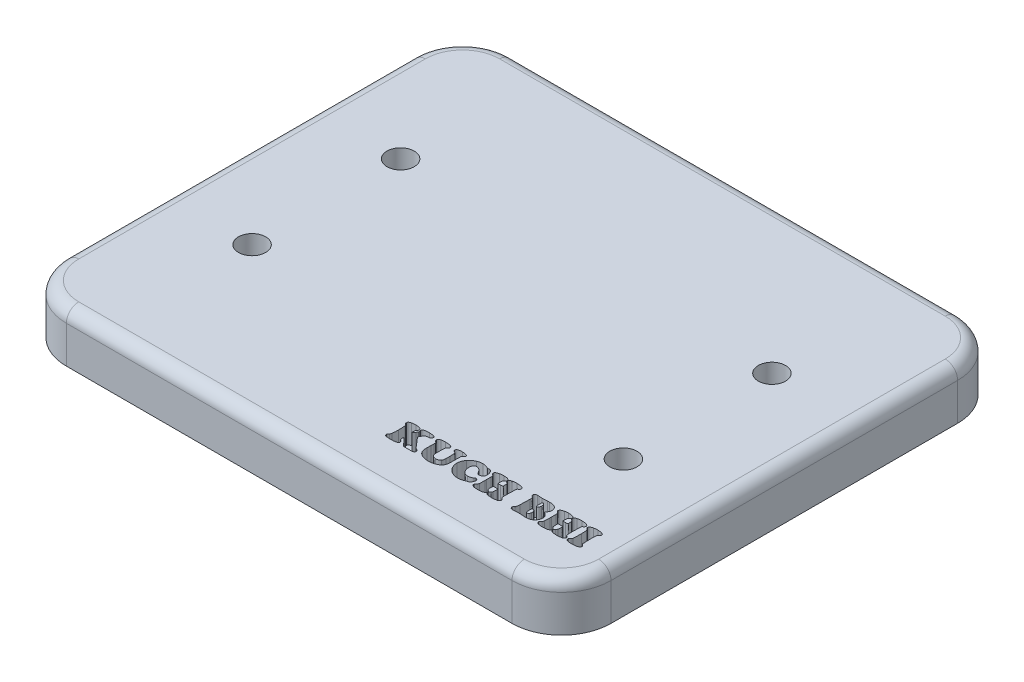
from build123d import *

# Parameters (mm, degrees)
BOSS_EXTRUDE1_DEPTH = 20
FILLET1_R           = 5
SKETCH2_R           = 5.5
CUT_EXTRUDE1_DEPTH  = 144.527001021
SKETCH3_R           = 9
CUT_EXTRUDE2_DEPTH  = 11
CUT_EXTRUDE3_DEPTH  = 8


with BuildPart() as part:
    # Sketch1 → Boss-Extrude1 (new body)
    with BuildSketch(Plane(origin=(0, 0, 0), x_dir=(1, 0, 0), z_dir=(0, 1, 0))):
        with BuildLine():
            Line((-90, 90), (90, 90))
            ThreePointArc((90, 90), (104.142135624, 84.142135624), (110, 70))
            Line((110, 70), (110, -70))
            ThreePointArc((110, -70), (104.142135624, -84.142135624), (90, -90))
            Line((90, -90), (-90, -90))
            ThreePointArc((-90, -90), (-104.142135624, -84.142135624), (-110, -70))
            Line((-110, -70), (-110, 70))
            ThreePointArc((-110, 70), (-104.142135624, 84.142135624), (-90, 90))
        make_face()
    extrude(amount=BOSS_EXTRUDE1_DEPTH)

    # Fillet1
    fillet1_edges = [part.edges().sort_by_distance(p)[0] for p in [
        (110, 20, 0),
        (104.142135624, 20, 84.142135624),
        (0, 20, 90),
        (-104.142135624, 20, 84.142135624),
        (-110, 20, 0),
        (-104.142135624, 20, -84.142135624),
        (0, 20, -90),
        (104.142135624, 20, -84.142135624),
    ]]
    fillet(fillet1_edges, radius=FILLET1_R)

    # Sketch2 → Cut-Extrude1 (cut, through all)
    with BuildSketch(Plane(origin=(0, 20, 0), x_dir=(1, 0, 0), z_dir=(0, 1, 0))):
        with Locations((-75, 30)):
            Circle(SKETCH2_R)
        with Locations((75, 30)):
            Circle(SKETCH2_R)
    cut_extrude1 = extrude(amount=-CUT_EXTRUDE1_DEPTH, mode=Mode.SUBTRACT)

    # Sketch3 → Cut-Extrude2 (cut)
    with BuildSketch(Plane.XZ):
        with Locations((-75, -30)):
            Circle(SKETCH3_R)
        with Locations((75, -30)):
            Circle(SKETCH3_R)
    cut_extrude2 = extrude(amount=-CUT_EXTRUDE2_DEPTH, mode=Mode.SUBTRACT)

    # Mirror1: Cut-Extrude1, Cut-Extrude2 across plane
    add(cut_extrude1.mirror(Plane.XY), mode=Mode.SUBTRACT)
    add(cut_extrude2.mirror(Plane.XY), mode=Mode.SUBTRACT)

    # Sketch4 → Cut-Extrude3 (cut)
    # profile 1 of 7: a face of its own
    with BuildSketch(Plane(origin=(0, 20, 0), x_dir=(1, 0, 0), z_dir=(0, 1, 0))):
        with BuildLine():
            Line((26.802918754, -62.21455254), (26.078678889, -62.978910649))
            add(Edge.make_bspline(
                [(26.078678889, -62.978910649), (26.032432407, -63.032420513), (25.944650897, -63.133988815), (25.848322621, -63.301129207), (25.786462489, -63.46803987), (25.778487402, -63.580914481), (25.774624835, -63.635582946)],
                knots=[0, 0, 0, 0, 1.144639861, 2.172667224, 3.114969454, 4, 4, 4, 4], degree=3))
            add(Edge.make_bspline(
                [(25.774624835, -63.635582946), (25.778360905, -63.697463336), (25.78583694, -63.821288634), (25.845994851, -63.96937359), (25.913701605, -64.086979352), (25.98224502, -64.185415593), (26.063946421, -64.295134856), (26.126132579, -64.369292941), (26.158915375, -64.408387)],
                knots=[0, 0, 0, 0, 1.257204683, 2.51572015, 3.210175855, 4.026456452, 4.959603267, 6, 6, 6, 6], degree=3))
            Line((26.158915375, -64.408387), (28.83628024, -67.512272135))
            add(Edge.make_bspline(
                [(28.83628024, -67.512272135), (28.894660335, -67.581973805), (28.998869259, -67.706391831), (29.137450808, -67.870991652), (29.245240073, -67.987187677), (29.343960843, -68.086864306), (29.466092822, -68.172316282), (29.567534764, -68.22378404), (29.621753213, -68.251292405)],
                knots=[0, 0, 0, 0, 1.502282813, 2.68158656, 3.553801245, 4.121219401, 4.995833793, 6, 6, 6, 6], degree=3))
            add(Edge.make_bspline(
                [(29.621753213, -68.251292405), (29.696996203, -68.281555517), (29.837425279, -68.338036804), (30.024890834, -68.437825287), (30.177191952, -68.53960754), (30.293729641, -68.649879465), (30.37748405, -68.767978085), (30.442953493, -68.892397268), (30.474797505, -69.031712484), (30.480393858, -69.127442913), (30.4832397, -69.176123486)],
                knots=[0, 0, 0, 0, 1.434081198, 2.676484527, 3.750796552, 4.666772852, 5.496299456, 6.303847937, 7.137477439, 8, 8, 8, 8], degree=3))
            add(Edge.make_bspline(
                [(30.4832397, -69.176123486), (30.479639769, -69.240772223), (30.472716872, -69.365095852), (30.406603397, -69.537697809), (30.29795319, -69.68377037), (30.145582184, -69.800620422), (29.950996133, -69.888664538), (29.717458293, -69.952704915), (29.442000604, -69.989222466), (29.245318249, -69.993237253), (29.140334294, -69.995380243)],
                knots=[0, 0, 0, 0, 0.872565956, 1.677999775, 2.461478673, 3.309975026, 4.247969235, 5.337246801, 6.578691208, 8, 8, 8, 8], degree=3))
            Line((29.140334294, -69.995380243), (26.450300511, -69.995380243))
            add(Edge.make_bspline(
                [(26.450300511, -69.995380243), (26.398829984, -69.993904365), (26.301517021, -69.99111399), (26.163496477, -69.966537508), (26.044237757, -69.921364481), (25.93323121, -69.858677479), (25.826945613, -69.756862565), (25.704273732, -69.619102469), (25.556059463, -69.438874641), (25.453082142, -69.301859348), (25.396668754, -69.226799162)],
                knots=[0, 0, 0, 0, 0.900711183, 1.702933295, 2.439769861, 3.124391065, 3.918340174, 4.999839374, 6.356441751, 8, 8, 8, 8], degree=3))
            add(Edge.make_bspline(
                [(25.396668754, -69.226799162), (25.29850077, -69.095746949), (25.092691017, -68.820995219), (24.747072334, -68.406736745), (24.364700908, -67.960138278), (24.087854957, -67.659882304), (23.943966051, -67.503826189)],
                knots=[0, 0, 0, 0, 0.871293462, 1.826671836, 2.870426642, 4, 4, 4, 4], degree=3))
            add(Edge.make_bspline(
                [(23.943966051, -67.503826189), (23.884889796, -67.441842781), (23.777736309, -67.329416251), (23.632889352, -67.178691187), (23.516857557, -67.065667567), (23.42691133, -66.986802288), (23.357217412, -66.929739379), (23.295744629, -66.8956343), (23.243100896, -66.867852678), (23.208011294, -66.865224347), (23.192276862, -66.864045784)],
                knots=[0, 0, 0, 0, 2.053515339, 3.724700007, 5.013989091, 5.934982476, 6.596747831, 7.164170021, 7.625207792, 8, 8, 8, 8], degree=3))
            add(Edge.make_bspline(
                [(23.192276862, -66.864045784), (23.180328031, -66.866380824), (23.154761033, -66.871377125), (23.126976406, -66.908013866), (23.101072634, -66.956972808), (23.085211318, -67.028450611), (23.066911832, -67.116622719), (23.05823027, -67.225709656), (23.05170908, -67.353813156), (23.051121226, -67.446094822), (23.050807267, -67.495380243)],
                knots=[0, 0, 0, 0, 0.417645888, 0.893639891, 1.539982195, 2.392194852, 3.457424255, 4.734164094, 6.255795507, 8, 8, 8, 8], degree=3))
            add(Edge.make_bspline(
                [(23.050807267, -67.495380243), (23.051010993, -67.543953376), (23.051395191, -67.635555679), (23.059552154, -67.766047843), (23.07497646, -67.882148093), (23.091974338, -67.98506301), (23.118386727, -68.073050329), (23.146728076, -68.147488116), (23.181900036, -68.208977155), (23.213386545, -68.239207963), (23.228172132, -68.253403892)],
                knots=[0, 0, 0, 0, 1.46211688, 2.757352993, 3.932086421, 4.987659448, 5.892805851, 6.691507231, 7.385551634, 8, 8, 8, 8], degree=3))
            add(Edge.make_bspline(
                [(23.228172132, -68.253403892), (23.237958627, -68.260540779), (23.263364618, -68.279068319), (23.312563679, -68.309463525), (23.376493422, -68.35469432), (23.4264658, -68.386004492), (23.454101186, -68.403319432)],
                knots=[0, 0, 0, 0, 0.535837127, 1.391046829, 2.55721438, 4, 4, 4, 4], degree=3))
            add(Edge.make_bspline(
                [(23.454101186, -68.403319432), (23.496837589, -68.430034096), (23.578753296, -68.481239869), (23.688961695, -68.566862952), (23.784760959, -68.651979884), (23.862461387, -68.741962117), (23.922114389, -68.835232964), (23.965025648, -68.931210098), (23.991865374, -69.029685509), (23.995128177, -69.096429169), (23.996753213, -69.129670784)],
                knots=[0, 0, 0, 0, 1.273705656, 2.441396354, 3.524934978, 4.509518135, 5.437792039, 6.31428324, 7.160430415, 8, 8, 8, 8], degree=3))
            add(Edge.make_bspline(
                [(23.996753213, -69.129670784), (23.995025806, -69.172843291), (23.991654638, -69.257097773), (23.956115159, -69.378612288), (23.897634926, -69.489584316), (23.818640639, -69.592875274), (23.714332105, -69.683975281), (23.589228114, -69.766133806), (23.441172669, -69.837657252), (23.271381043, -69.900668494), (23.077585799, -69.954686208), (22.85993418, -70.003358246), (22.617336293, -70.042641618), (22.350230359, -70.073609998), (22.058700722, -70.098587052), (21.741908764, -70.117878165), (21.400390085, -70.127648161), (21.164551028, -70.129539071), (21.042783619, -70.130515378)],
                knots=[0, 0, 0, 0, 0.610641544, 1.191714125, 1.776287946, 2.380950292, 3.023909509, 3.729535071, 4.496990646, 5.349430785, 6.293673728, 7.346619652, 8.509535439, 9.775521389, 11.157550897, 12.656800858, 14.273853771, 16, 16, 16, 16], degree=3))
            add(Edge.make_bspline(
                [(21.042783619, -70.130515378), (20.937201372, -70.130343812), (20.733037672, -70.130012054), (20.438105533, -70.120903707), (20.164947642, -70.108685898), (19.913647791, -70.091639332), (19.68385121, -70.071953713), (19.476319399, -70.043543981), (19.289782314, -70.013834692), (19.1739718, -69.98553384), (19.11921943, -69.972153892)],
                knots=[0, 0, 0, 0, 1.309924044, 2.532991556, 3.66071905, 4.702247989, 5.658102377, 6.521397233, 7.300952872, 8, 8, 8, 8], degree=3))
            add(Edge.make_bspline(
                [(19.11921943, -69.972153892), (19.072255872, -69.956549044), (18.980722714, -69.926134803), (18.852930261, -69.858919961), (18.739607843, -69.77435285), (18.638872184, -69.675383673), (18.55946018, -69.561006231), (18.498685231, -69.438420698), (18.464039328, -69.3053553), (18.458864353, -69.214322939), (18.456212673, -69.16767754)],
                knots=[0, 0, 0, 0, 1.059415345, 2.064827201, 3.078579125, 4.081271196, 5.077359796, 6.048929802, 7.000262712, 8, 8, 8, 8], degree=3))
            add(Edge.make_bspline(
                [(18.456212673, -69.16767754), (18.461894064, -69.095641334), (18.473238512, -68.951801404), (18.566999902, -68.748995556), (18.716018077, -68.565669722), (18.848342298, -68.470671171), (18.918628213, -68.420211324)],
                knots=[0, 0, 0, 0, 0.939520066, 1.876008027, 2.871811094, 4, 4, 4, 4], degree=3))
            add(Edge.make_bspline(
                [(18.918628213, -68.420211324), (18.96530695, -68.385324416), (19.052257287, -68.320339186), (19.130961266, -68.207050211), (19.176963882, -68.102752893), (19.206419258, -67.998605679), (19.238531893, -67.869130369), (19.256962756, -67.77350672), (19.267023484, -67.721309297)],
                knots=[0, 0, 0, 0, 1.292040983, 2.406736084, 3.024996391, 3.829212685, 4.815047265, 6, 6, 6, 6], degree=3))
            add(Edge.make_bspline(
                [(19.267023484, -67.721309297), (19.278091853, -67.650996772), (19.301610686, -67.501591871), (19.327902256, -67.26342324), (19.35106777, -66.999420835), (19.369746896, -66.71006022), (19.384401407, -66.394693827), (19.394660661, -66.053291092), (19.401053509, -65.685860927), (19.401782169, -65.43246073), (19.402158619, -65.301545784)],
                knots=[0, 0, 0, 0, 0.70410058, 1.496121435, 2.369873404, 3.325875229, 4.364522422, 5.493082839, 6.704843455, 8, 8, 8, 8], degree=3))
            add(Edge.make_bspline(
                [(19.402158619, -65.301545784), (19.401785533, -65.145997254), (19.401066338, -64.846147654), (19.394704541, -64.413265172), (19.384458676, -64.014857003), (19.36990897, -63.651630363), (19.351337224, -63.324256973), (19.328166915, -63.032099239), (19.30193221, -62.774215721), (19.278119564, -62.614257754), (19.267023484, -62.539721459)],
                knots=[0, 0, 0, 0, 1.348933748, 2.600328302, 3.75433313, 4.805040337, 5.752708906, 6.597692569, 7.346560842, 8, 8, 8, 8], degree=3))
            add(Edge.make_bspline(
                [(19.267023484, -62.539721459), (19.258808096, -62.491845042), (19.24352088, -62.402756469), (19.219266176, -62.280782342), (19.183985954, -62.183987177), (19.136096358, -62.079560722), (19.034373266, -61.966227342), (18.933200621, -61.898082112), (18.876398484, -61.859822811)],
                knots=[0, 0, 0, 0, 1.067002038, 1.985480432, 2.723486221, 3.324743107, 4.498009907, 6, 6, 6, 6], degree=3))
            add(Edge.make_bspline(
                [(18.876398484, -61.859822811), (18.812325242, -61.814337283), (18.689392551, -61.727067494), (18.554246512, -61.548085917), (18.468281658, -61.343486592), (18.460303242, -61.196277362), (18.456212673, -61.12080254)],
                knots=[0, 0, 0, 0, 1.054734211, 2.023642201, 2.986712639, 4, 4, 4, 4], degree=3))
            add(Edge.make_bspline(
                [(18.456212673, -61.12080254), (18.459133355, -61.057078359), (18.464753864, -60.934448657), (18.517047093, -60.761131094), (18.603195101, -60.609058832), (18.726544382, -60.479053834), (18.884358272, -60.369721079), (19.075135451, -60.274916283), (19.300441813, -60.194432285), (19.464986636, -60.158159288), (19.552074159, -60.138961324)],
                knots=[0, 0, 0, 0, 0.944713437, 1.817990051, 2.660946763, 3.519069943, 4.456173266, 5.498905555, 6.676262693, 8, 8, 8, 8], degree=3))
            add(Edge.make_bspline(
                [(19.552074159, -60.138961324), (19.675702043, -60.116158216), (19.93651421, -60.068051527), (20.353036156, -60.027730901), (20.811511902, -59.9988891), (21.131409893, -59.996583092), (21.298273484, -59.995380243)],
                knots=[0, 0, 0, 0, 0.859311067, 1.812849773, 2.859149627, 4, 4, 4, 4], degree=3))
            add(Edge.make_bspline(
                [(21.298273484, -59.995380243), (21.389782045, -59.996282673), (21.565823338, -59.998018739), (21.820720321, -60.008661739), (22.057322801, -60.025448288), (22.275886975, -60.047544253), (22.476241197, -60.07880745), (22.656759043, -60.119995802), (22.820975375, -60.161682098), (22.920908671, -60.20065404), (22.968459294, -60.219197811)],
                knots=[0, 0, 0, 0, 1.296086799, 2.493371012, 3.612712099, 4.655241835, 5.604157051, 6.482140322, 7.277766495, 8, 8, 8, 8], degree=3))
            add(Edge.make_bspline(
                [(22.968459294, -60.219197811), (23.017612085, -60.242031248), (23.112147011, -60.285946502), (23.239450437, -60.367079156), (23.349664424, -60.454989849), (23.43649239, -60.556671401), (23.50798166, -60.664153085), (23.557202253, -60.782368038), (23.584692886, -60.90980536), (23.589085091, -60.997500136), (23.591347808, -61.04267754)],
                knots=[0, 0, 0, 0, 1.180346569, 2.270145296, 3.283942015, 4.240989658, 5.173109903, 6.087891605, 7.014945942, 8, 8, 8, 8], degree=3))
            add(Edge.make_bspline(
                [(23.591347808, -61.04267754), (23.588500736, -61.107181573), (23.583259537, -61.225927609), (23.531630115, -61.370696308), (23.454116145, -61.475494857), (23.365614125, -61.575435659), (23.242921134, -61.696678665), (23.14762134, -61.782827653), (23.095148484, -61.830262)],
                knots=[0, 0, 0, 0, 1.196767847, 2.20314037, 2.794976518, 3.611238618, 4.684728172, 6, 6, 6, 6], degree=3))
            add(Edge.make_bspline(
                [(23.095148484, -61.830262), (23.090737087, -61.840047196), (23.075783275, -61.873217183), (23.058225895, -61.946964456), (23.030562687, -62.062508489), (22.978313973, -62.270776294), (22.928771154, -62.565095753), (22.920046874, -62.808361971), (22.915672132, -62.930346459)],
                knots=[0, 0, 0, 0, 0.172470392, 0.584642403, 1.213566365, 2.086924847, 4.037810295, 6, 6, 6, 6], degree=3))
            add(Edge.make_bspline(
                [(22.915672132, -62.930346459), (22.916208335, -62.996565103), (22.917126767, -63.109987398), (22.912356748, -63.251677896), (22.914798499, -63.338018361), (22.905326614, -63.375196472), (22.903003213, -63.384316054)],
                knots=[0, 0, 0, 0, 1.745606799, 2.989954477, 3.752241495, 4, 4, 4, 4], degree=3))
            add(Edge.make_bspline(
                [(22.903003213, -63.384316054), (22.940149636, -63.377230604), (23.025902428, -63.360873792), (23.104599628, -63.288324965), (23.167205561, -63.226281929), (23.213424787, -63.175182107), (23.26961642, -63.109770912), (23.338053723, -63.032243509), (23.413478097, -62.937670941), (23.50202542, -62.831734762), (23.599430147, -62.71031857), (23.667393088, -62.624909427), (23.703256592, -62.579839703)],
                knots=[0, 0, 0, 0, 0.967350676, 2.2331362, 2.672881924, 3.268394091, 4.020330404, 4.915095544, 5.954951975, 7.163405159, 8.503151468, 10, 10, 10, 10], degree=3))
            add(Edge.make_bspline(
                [(23.703256592, -62.579839703), (23.743080408, -62.529473211), (23.818534429, -62.434044025), (23.919114616, -62.294228312), (24.006705316, -62.169579038), (24.078356344, -62.058615636), (24.134286563, -61.961685502), (24.172860221, -61.878333285), (24.198775626, -61.808510562), (24.203648092, -61.764953386), (24.205790375, -61.74580254)],
                knots=[0, 0, 0, 0, 1.567551932, 2.970034233, 4.204756485, 5.286892547, 6.194959732, 6.933133249, 7.530929187, 8, 8, 8, 8], degree=3))
            add(Edge.make_bspline(
                [(24.205790375, -61.74580254), (24.204342422, -61.727377036), (24.200986812, -61.684676209), (24.176661431, -61.614242912), (24.140447712, -61.528077267), (24.110394561, -61.465548202), (24.093881592, -61.431191054)],
                knots=[0, 0, 0, 0, 0.657730594, 1.52428071, 2.639694144, 4, 4, 4, 4], degree=3))
            add(Edge.make_bspline(
                [(24.093881592, -61.431191054), (24.066135037, -61.36739833), (24.013824024, -61.247128911), (24.002207947, -61.116627802), (23.996753213, -61.055346459)],
                knots=[0, 0, 0, 0, 1.060830323, 2, 2, 2, 2], degree=3))
            add(Edge.make_bspline(
                [(23.996753213, -61.055346459), (23.999073933, -61.007381833), (24.00358412, -60.914165336), (24.030064351, -60.77943961), (24.080024385, -60.656989677), (24.14859281, -60.545804705), (24.23605275, -60.444710564), (24.345269379, -60.358921881), (24.472373722, -60.283727322), (24.619856232, -60.221339827), (24.787977478, -60.166487373), (24.979320526, -60.120177851), (25.194861073, -60.084288537), (25.433259029, -60.049329397), (25.695424703, -60.024798009), (25.981384733, -60.008699471), (26.291156563, -59.998023964), (26.505893744, -59.996282278), (26.617107943, -59.995380243)],
                knots=[0, 0, 0, 0, 0.734580586, 1.427615184, 2.089817431, 2.74762312, 3.419569276, 4.124559353, 4.863629457, 5.674228806, 6.570250574, 7.568420608, 8.684304621, 9.91386126, 11.256025093, 12.713008658, 14.297639432, 16, 16, 16, 16], degree=3))
            add(Edge.make_bspline(
                [(26.617107943, -59.995380243), (26.707905459, -59.995763035), (26.883893251, -59.996504979), (27.138730419, -60.002820103), (27.375267448, -60.013238725), (27.59287575, -60.027451099), (27.791949345, -60.047391956), (27.973313005, -60.06675051), (28.136090892, -60.094022852), (28.237418282, -60.117389335), (28.285182267, -60.128403892)],
                knots=[0, 0, 0, 0, 1.299584259, 2.518912117, 3.648323204, 4.688338057, 5.639623973, 6.511824757, 7.298499838, 8, 8, 8, 8], degree=3))
            add(Edge.make_bspline(
                [(28.285182267, -60.128403892), (28.351834642, -60.146606952), (28.478183994, -60.181113523), (28.651145957, -60.253593164), (28.798939756, -60.337688083), (28.920647954, -60.434847044), (29.017120507, -60.544084246), (29.083335519, -60.667784226), (29.125810697, -60.803433843), (29.129828182, -60.898771492), (29.131888348, -60.947660649)],
                knots=[0, 0, 0, 0, 1.294304717, 2.453544422, 3.506019197, 4.472590419, 5.36145047, 6.217679692, 7.086025967, 8, 8, 8, 8], degree=3))
            add(Edge.make_bspline(
                [(29.131888348, -60.947660649), (29.129957152, -60.984520331), (29.126014686, -61.059768031), (29.089246116, -61.171002815), (29.032837175, -61.281974614), (28.958070231, -61.392810102), (28.862365291, -61.496595241), (28.742222434, -61.581583486), (28.604240247, -61.653195556), (28.501248773, -61.682184694), (28.447766727, -61.697238351)],
                knots=[0, 0, 0, 0, 0.810370042, 1.654340927, 2.55620266, 3.550092361, 4.592665796, 5.647629403, 6.778446548, 8, 8, 8, 8], degree=3))
            add(Edge.make_bspline(
                [(28.447766727, -61.697238351), (28.411969875, -61.704896019), (28.322166095, -61.724106855), (28.155899476, -61.737741026), (27.93269354, -61.747484517), (27.764372366, -61.750474018), (27.6707397, -61.752137)],
                knots=[0, 0, 0, 0, 0.562561762, 1.411302107, 2.559975064, 4, 4, 4, 4], degree=3))
            add(Edge.make_bspline(
                [(27.6707397, -61.752137), (27.625649064, -61.75350441), (27.541538927, -61.756055119), (27.424806948, -61.770456231), (27.32672069, -61.792749447), (27.239976274, -61.82646467), (27.155851346, -61.884559888), (27.056401959, -61.966426235), (26.934473268, -62.077869973), (26.849519164, -62.166135626), (26.802918754, -62.21455254)],
                knots=[0, 0, 0, 0, 1.056157488, 1.970110847, 2.74977056, 3.407907489, 4.134903294, 5.131218911, 6.426369419, 8, 8, 8, 8], degree=3))
        make_face()
    # profile 2 of 7: a face of its own
    with BuildSketch(Plane(origin=(0, 20, 0), x_dir=(1, 0, 0), z_dir=(0, 1, 0))):
        with BuildLine():
            Line((41.291939024, -63.766495108), (41.294050511, -65.468353216))
            add(Edge.make_bspline(
                [(41.294050511, -65.468353216), (41.292990328, -65.592225916), (41.290941852, -65.831571628), (41.282340945, -66.178141688), (41.259072894, -66.497516771), (41.236586215, -66.790931845), (41.199398759, -67.056921825), (41.158484635, -67.297479186), (41.10948739, -67.511800271), (41.065570242, -67.642763208), (41.044895105, -67.704417405)],
                knots=[0, 0, 0, 0, 1.315998442, 2.542760293, 3.681687839, 4.717377219, 5.667987535, 6.533358337, 7.309540413, 8, 8, 8, 8], degree=3))
            add(Edge.make_bspline(
                [(41.044895105, -67.704417405), (40.998747645, -67.817164389), (40.906572638, -68.042365385), (40.711353879, -68.353970195), (40.480525054, -68.645836489), (40.205060555, -68.913851567), (39.885671921, -69.155972486), (39.52672446, -69.377399682), (39.127870049, -69.580625066), (38.840961469, -69.689805152), (38.692699159, -69.746224838)],
                knots=[0, 0, 0, 0, 0.906892554, 1.811428571, 2.73017801, 3.676495972, 4.668396145, 5.712521538, 6.817927157, 8, 8, 8, 8], degree=3))
            add(Edge.make_bspline(
                [(38.692699159, -69.746224838), (38.604346354, -69.777512573), (38.425656703, -69.840790637), (38.148919436, -69.917607724), (37.862972467, -69.983692101), (37.566778469, -70.035743293), (37.260383286, -70.077691161), (36.943598699, -70.110487399), (36.616566643, -70.126202284), (36.395414213, -70.12906607), (36.283493078, -70.130515378)],
                knots=[0, 0, 0, 0, 0.917111739, 1.854818053, 2.80897837, 3.788633903, 4.796933389, 5.835372595, 6.90452229, 8, 8, 8, 8], degree=3))
            add(Edge.make_bspline(
                [(36.283493078, -70.130515378), (36.096163586, -70.127368701), (35.729940815, -70.121217053), (35.194887974, -70.070443312), (34.688805077, -69.984275385), (34.211352868, -69.864020673), (33.761720874, -69.710052815), (33.340535967, -69.521632655), (32.945513874, -69.301546324), (32.706931901, -69.12324396), (32.588391727, -69.034653892)],
                knots=[0, 0, 0, 0, 1.14469758, 2.237844752, 3.280903698, 4.279298737, 5.243749819, 6.181441706, 7.096443816, 8, 8, 8, 8], degree=3))
            add(Edge.make_bspline(
                [(32.588391727, -69.034653892), (32.479330827, -68.942520064), (32.267189436, -68.763304613), (32.001853638, -68.451844212), (31.784766732, -68.123530717), (31.650053865, -67.826801271), (31.569046743, -67.573243335), (31.517449549, -67.363416787), (31.469724424, -67.135581061), (31.436112365, -66.88772439), (31.404863166, -66.621824729), (31.388051476, -66.33562364), (31.374208824, -66.030847608), (31.372865133, -65.820990639), (31.372175511, -65.713285649)],
                knots=[0, 0, 0, 0, 1.392436625, 2.708518293, 3.980333235, 5.22632031, 5.876358537, 6.578306165, 7.33600783, 8.148779146, 9.020306078, 9.95043378, 10.948100175, 12, 12, 12, 12], degree=3))
            add(Edge.make_bspline(
                [(31.372175511, -65.713285649), (31.372010023, -65.666831774), (31.371656466, -65.567584713), (31.374721967, -65.408532275), (31.376004713, -65.229738695), (31.380514929, -65.030549402), (31.387349306, -64.810988391), (31.39363825, -64.570276302), (31.399345599, -64.309120586), (31.405095119, -64.128258818), (31.408070781, -64.034653892)],
                knots=[0, 0, 0, 0, 0.663973072, 1.418554993, 2.273731004, 3.219603645, 4.26629945, 5.413559074, 6.661388669, 8, 8, 8, 8], degree=3))
            add(Edge.make_bspline(
                [(31.408070781, -64.034653892), (31.409456356, -63.969197293), (31.412123267, -63.843208565), (31.416272244, -63.663730475), (31.420445261, -63.501142465), (31.425013439, -63.356888172), (31.427827789, -63.228781577), (31.426019392, -63.118952729), (31.429770935, -63.026082059), (31.429368848, -62.970466798), (31.429185646, -62.945126865)],
                knots=[0, 0, 0, 0, 1.441858512, 2.775242249, 3.953670684, 5.023638578, 5.953784004, 6.775298372, 7.441990241, 8, 8, 8, 8], degree=3))
            add(Edge.make_bspline(
                [(31.429185646, -62.945126865), (31.428763449, -62.861346899), (31.427989186, -62.707703486), (31.413452945, -62.499639897), (31.392527844, -62.335427625), (31.359772741, -62.206781761), (31.302316187, -62.104547766), (31.231283578, -62.007079372), (31.128131284, -61.92035291), (31.0515992, -61.865575455), (31.011111321, -61.836596459)],
                knots=[0, 0, 0, 0, 1.598825354, 2.932073083, 3.976962726, 4.759347985, 5.444462097, 6.202122467, 7.048866256, 8, 8, 8, 8], degree=3))
            add(Edge.make_bspline(
                [(31.011111321, -61.836596459), (30.968855463, -61.808706511), (30.887813815, -61.75521695), (30.782239939, -61.662409922), (30.690273171, -61.570466271), (30.615531658, -61.473867561), (30.554395155, -61.375066631), (30.515516058, -61.26994849), (30.487756904, -61.163054463), (30.48475253, -61.090013958), (30.4832397, -61.053234973)],
                knots=[0, 0, 0, 0, 1.230358883, 2.359680167, 3.413231621, 4.389489361, 5.326352533, 6.226336239, 7.106885251, 8, 8, 8, 8], degree=3))
            add(Edge.make_bspline(
                [(30.4832397, -61.053234973), (30.486591769, -61.000072711), (30.493260663, -60.894307138), (30.543907316, -60.742161657), (30.626393473, -60.601032611), (30.742134938, -60.476008847), (30.880531092, -60.364197146), (31.041121844, -60.274024342), (31.218189603, -60.200465037), (31.344896773, -60.169629598), (31.410182267, -60.15374173)],
                knots=[0, 0, 0, 0, 0.91120899, 1.812837481, 2.722443357, 3.697636338, 4.720241843, 5.764665201, 6.848250372, 8, 8, 8, 8], degree=3))
            add(Edge.make_bspline(
                [(31.410182267, -60.15374173), (31.541527151, -60.128746077), (31.814183747, -60.076858029), (32.244085968, -60.031690589), (32.706188347, -60.001256392), (33.0254125, -59.99738057), (33.190165375, -59.995380243)],
                knots=[0, 0, 0, 0, 0.896033859, 1.860061356, 2.895569016, 4, 4, 4, 4], degree=3))
            add(Edge.make_bspline(
                [(33.190165375, -59.995380243), (33.373932634, -59.996993707), (33.724918168, -60.000075335), (34.226680346, -60.034367546), (34.678594432, -60.087706975), (34.95991554, -60.146923949), (35.0926147, -60.174856594)],
                knots=[0, 0, 0, 0, 1.151421672, 2.199153167, 3.15054059, 4, 4, 4, 4], degree=3))
            add(Edge.make_bspline(
                [(35.0926147, -60.174856594), (35.165579866, -60.193705186), (35.304642426, -60.229628264), (35.495921273, -60.305249023), (35.657972838, -60.396108606), (35.793225185, -60.499860336), (35.896178484, -60.622067048), (35.969596498, -60.758681163), (36.016143066, -60.909495948), (36.021187167, -61.015587352), (36.02378024, -61.070126865)],
                knots=[0, 0, 0, 0, 1.283815814, 2.446793767, 3.494452655, 4.442578967, 5.336633099, 6.195541623, 7.072363277, 8, 8, 8, 8], degree=3))
            add(Edge.make_bspline(
                [(36.02378024, -61.070126865), (36.020805292, -61.122018312), (36.014857325, -61.225767518), (35.957061123, -61.375030951), (35.869355428, -61.517330011), (35.789096351, -61.599447945), (35.747175511, -61.642339703)],
                knots=[0, 0, 0, 0, 0.949156634, 1.897697074, 2.901927245, 4, 4, 4, 4], degree=3))
            add(Edge.make_bspline(
                [(35.747175511, -61.642339703), (35.736690906, -61.649495885), (35.700164705, -61.674426546), (35.616329393, -61.718589252), (35.483311965, -61.790927828), (35.377695629, -61.847894076), (35.316432267, -61.880937676)],
                knots=[0, 0, 0, 0, 0.309120746, 1.076912883, 2.304446536, 4, 4, 4, 4], degree=3))
            add(Edge.make_bspline(
                [(35.316432267, -61.880937676), (35.304420111, -61.889403765), (35.2754202, -61.909842714), (35.246819004, -61.968221535), (35.215768584, -62.045549636), (35.182493564, -62.151038383), (35.155443764, -62.292290974), (35.138292351, -62.477419363), (35.1289079, -62.709240582), (35.127283921, -62.879659288), (35.126398484, -62.972576189)],
                knots=[0, 0, 0, 0, 0.307772173, 0.743027754, 1.339072747, 2.089846878, 3.079458784, 4.385225527, 6.029126904, 8, 8, 8, 8], degree=3))
            add(Edge.make_bspline(
                [(35.126398484, -62.972576189), (35.126640935, -63.02114303), (35.127213757, -63.135888368), (35.121201923, -63.333625415), (35.117516412, -63.584195686), (35.114408914, -63.887593231), (35.104172, -64.244371404), (35.096910354, -64.654039777), (35.085938893, -65.116447782), (35.077865871, -65.442312431), (35.073611321, -65.614045784)],
                knots=[0, 0, 0, 0, 0.44115126, 1.042275949, 1.796816895, 2.717569188, 3.798372708, 5.038974654, 6.439515269, 8, 8, 8, 8], degree=3))
            add(Edge.make_bspline(
                [(35.073611321, -65.614045784), (35.072654947, -65.70911826), (35.070802586, -65.893260108), (35.095275252, -66.160081452), (35.135537886, -66.407963522), (35.199849416, -66.636410367), (35.282458751, -66.845972645), (35.390753724, -67.034340029), (35.515932406, -67.205063984), (35.61689364, -67.301757669), (35.666939024, -67.349687676)],
                knots=[0, 0, 0, 0, 1.203262213, 2.330547575, 3.388472087, 4.378917376, 5.330586695, 6.23267568, 7.123956571, 8, 8, 8, 8], degree=3))
            add(Edge.make_bspline(
                [(35.666939024, -67.349687676), (35.712538395, -67.388824105), (35.802927318, -67.466401921), (35.9533615, -67.562642063), (36.108395888, -67.648123363), (36.27240046, -67.715314774), (36.443197062, -67.76897089), (36.622018867, -67.806887039), (36.808779032, -67.827382188), (36.935192921, -67.831254666), (36.999286997, -67.833218081)],
                knots=[0, 0, 0, 0, 0.993175809, 1.968713353, 2.948413358, 3.919561117, 4.895724161, 5.907638874, 6.939135925, 8, 8, 8, 8], degree=3))
            add(Edge.make_bspline(
                [(36.999286997, -67.833218081), (37.090920282, -67.83081669), (37.269286407, -67.826142333), (37.529410044, -67.788806468), (37.775002994, -67.731434507), (38.003373733, -67.646255068), (38.210761934, -67.541872131), (38.395399482, -67.42147487), (38.552616762, -67.281827244), (38.635190621, -67.173044158), (38.675807267, -67.119535649)],
                knots=[0, 0, 0, 0, 1.162490976, 2.262813231, 3.328768946, 4.357546368, 5.348274231, 6.269905075, 7.148996372, 8, 8, 8, 8], degree=3))
            add(Edge.make_bspline(
                [(38.675807267, -67.119535649), (38.70502445, -67.077243375), (38.76343959, -66.992686655), (38.832581482, -66.852984306), (38.890259176, -66.706468417), (38.930788676, -66.545970726), (38.959423785, -66.366413193), (38.983098141, -66.160068316), (38.994440091, -65.923152449), (38.995952839, -65.755523239), (38.996753213, -65.666832946)],
                knots=[0, 0, 0, 0, 0.813592064, 1.626648795, 2.463456555, 3.304786231, 4.243601192, 5.34350544, 6.594485522, 8, 8, 8, 8], degree=3))
            Line((38.996753213, -65.666832946), (38.996753213, -64.127559297))
            add(Edge.make_bspline(
                [(38.996753213, -64.127559297), (38.994251716, -63.988897281), (38.989527629, -63.727033474), (38.978121177, -63.357559401), (38.968668489, -63.034432168), (38.955684424, -62.75784113), (38.942880584, -62.527713374), (38.931966541, -62.344440827), (38.916696936, -62.207954607), (38.900283132, -62.087947738), (38.85835667, -61.972173205), (38.774929465, -61.856342604), (38.654013419, -61.761075126), (38.559232504, -61.712451053), (38.508999835, -61.686680919)],
                knots=[0, 0, 0, 0, 1.905360052, 3.598280547, 5.078562813, 6.34664578, 7.402258933, 8.245537248, 8.868100656, 9.289379284, 9.907344727, 10.537966578, 11.225141042, 12, 12, 12, 12], degree=3))
            add(Edge.make_bspline(
                [(38.508999835, -61.686680919), (38.447297159, -61.659488967), (38.331955777, -61.6086588), (38.177392132, -61.523402456), (38.049761414, -61.44244202), (37.948081053, -61.360516444), (37.86959423, -61.272095123), (37.819598997, -61.169587481), (37.785684539, -61.057492553), (37.782294041, -60.978196503), (37.780536997, -60.937103216)],
                knots=[0, 0, 0, 0, 1.447437424, 2.705708147, 3.787431483, 4.689342745, 5.504209531, 6.301931239, 7.120016366, 8, 8, 8, 8], degree=3))
            add(Edge.make_bspline(
                [(37.780536997, -60.937103216), (37.78205401, -60.896136268), (37.785014439, -60.816189847), (37.811253504, -60.700737532), (37.853102863, -60.593983038), (37.913954555, -60.497360503), (37.990457176, -60.409834608), (38.085512326, -60.333520104), (38.196373068, -60.265884887), (38.324037621, -60.206904712), (38.469335812, -60.156843954), (38.631424783, -60.112296697), (38.81183133, -60.078312421), (39.007932676, -60.04520914), (39.222373368, -60.023465579), (39.453972878, -60.005837677), (39.704063622, -59.998833773), (39.876539194, -59.996559102), (39.965925511, -59.995380243)],
                knots=[0, 0, 0, 0, 0.744897458, 1.453656896, 2.143637911, 2.822707077, 3.521788174, 4.250194683, 5.032499662, 5.880846439, 6.804778024, 7.827382898, 8.938023989, 10.14499782, 11.446725289, 12.859836519, 14.372594764, 16, 16, 16, 16], degree=3))
            add(Edge.make_bspline(
                [(39.965925511, -59.995380243), (40.05673068, -59.996286167), (40.232772134, -59.998042456), (40.488361304, -60.00881367), (40.727190118, -60.024954172), (40.948606746, -60.049343986), (41.15237715, -60.084826497), (41.339873871, -60.120581153), (41.510024552, -60.167137907), (41.662259861, -60.222131343), (41.797714014, -60.282494895), (41.915846414, -60.350284655), (42.015610003, -60.42593453), (42.097735312, -60.509647002), (42.162801292, -60.601047688), (42.206534958, -60.701956882), (42.235981349, -60.808751852), (42.238645477, -60.882708103), (42.239996457, -60.920211324)],
                knots=[0, 0, 0, 0, 1.621556189, 3.143665852, 4.567482936, 5.895786225, 7.119024177, 8.260286376, 9.303109213, 10.265250631, 11.148374588, 11.948142528, 12.692247341, 13.376635444, 14.035623393, 14.682636441, 15.331964828, 16, 16, 16, 16], degree=3))
            add(Edge.make_bspline(
                [(42.239996457, -60.920211324), (42.238840053, -60.953378232), (42.236604933, -61.017483897), (42.217990702, -61.108304584), (42.185970803, -61.188559155), (42.137599786, -61.262813885), (42.059706132, -61.336184866), (41.948677981, -61.421712575), (41.798100289, -61.524703428), (41.682883125, -61.596392928), (41.61921943, -61.636005243)],
                knots=[0, 0, 0, 0, 0.793332227, 1.533368454, 2.205909018, 2.850661672, 3.63680777, 4.752280929, 6.20546008, 8, 8, 8, 8], degree=3))
            add(Edge.make_bspline(
                [(41.61921943, -61.636005243), (41.584316429, -61.659269362), (41.517399275, -61.703872078), (41.437677655, -61.791092959), (41.378665665, -61.887447031), (41.348239601, -61.983332658), (41.336667626, -62.08417721), (41.325611592, -62.20166881), (41.318931129, -62.36094135), (41.309649088, -62.561464381), (41.303834715, -62.80363377), (41.300257743, -63.08729743), (41.295844832, -63.413169461), (41.293292822, -63.644028339), (41.291939024, -63.766495108)],
                knots=[0, 0, 0, 0, 0.673332869, 1.290935424, 1.88575596, 2.480792441, 2.892752768, 3.518723324, 4.381340819, 5.459076398, 6.751661554, 8.281992668, 10.02765937, 12, 12, 12, 12], degree=3))
        make_face()
    # profile 3 of 7: a face of its own
    with BuildSketch(Plane(origin=(0, 20, 0), x_dir=(1, 0, 0), z_dir=(0, 1, 0))):
        with BuildLine():
            add(Edge.make_bspline(
                [(48.232395105, -59.995380243), (48.415764961, -60.000961985), (48.779748118, -60.012041558), (49.316762267, -60.104005045), (49.839181697, -60.252222227), (50.169440475, -60.398868577), (50.335435646, -60.472576189)],
                knots=[0, 0, 0, 0, 1.011477081, 2.007748879, 2.998651702, 4, 4, 4, 4], degree=3))
            add(Edge.make_bspline(
                [(50.335435646, -60.472576189), (50.398531891, -60.502082345), (50.509968026, -60.554194035), (50.658952131, -60.6144856), (50.765453653, -60.657948841), (50.825836421, -60.667475879), (50.848526862, -60.671055919)],
                knots=[0, 0, 0, 0, 1.513898858, 2.673741322, 3.501622802, 4, 4, 4, 4], degree=3))
            add(Edge.make_bspline(
                [(50.848526862, -60.671055919), (50.871070398, -60.669912451), (50.921957349, -60.667331331), (51.007330864, -60.656155195), (51.110576938, -60.636286637), (51.185687423, -60.620505608), (51.226482943, -60.611934297)],
                knots=[0, 0, 0, 0, 0.706914905, 1.595701026, 2.69412871, 4, 4, 4, 4], degree=3))
            add(Edge.make_bspline(
                [(51.226482943, -60.611934297), (51.26367029, -60.604548573), (51.34172334, -60.589046571), (51.421303951, -60.587438425), (51.46296943, -60.586596459)],
                knots=[0, 0, 0, 0, 0.952873626, 2, 2, 2, 2], degree=3))
            add(Edge.make_bspline(
                [(51.46296943, -60.586596459), (51.547993153, -60.591338112), (51.711498666, -60.600456583), (51.943992148, -60.674702311), (52.147878639, -60.801718872), (52.25517718, -60.919506879), (52.309675511, -60.979332946)],
                knots=[0, 0, 0, 0, 1.054525785, 2.027913751, 2.998351633, 4, 4, 4, 4], degree=3))
            add(Edge.make_bspline(
                [(52.309675511, -60.979332946), (52.368669348, -61.055122818), (52.485979322, -61.205831914), (52.638287008, -61.446999927), (52.765575079, -61.699733181), (52.868608008, -61.963063596), (52.952722616, -62.23574677), (53.00761467, -62.520441139), (53.046210825, -62.814563247), (53.049260625, -63.014674853), (53.050807267, -63.11615727)],
                knots=[0, 0, 0, 0, 0.997974181, 1.984483991, 2.959559336, 3.935073782, 4.921095099, 5.921212583, 6.945786429, 8, 8, 8, 8], degree=3))
            add(Edge.make_bspline(
                [(53.050807267, -63.11615727), (53.049075371, -63.188789014), (53.045708939, -63.329969422), (53.010896782, -63.535711347), (52.953591552, -63.727281329), (52.877548285, -63.90875982), (52.775467932, -64.075114461), (52.651352026, -64.229106613), (52.5048774, -64.369413453), (52.393749935, -64.449782733), (52.337124835, -64.490734973)],
                knots=[0, 0, 0, 0, 1.076513724, 2.092509933, 3.083418626, 4.037458411, 5.002458329, 5.96762763, 6.964402821, 8, 8, 8, 8], degree=3))
            add(Edge.make_bspline(
                [(52.337124835, -64.490734973), (52.276337882, -64.527621291), (52.153518455, -64.602149726), (51.942600988, -64.671710922), (51.714149238, -64.717561898), (51.554014812, -64.722541453), (51.471415375, -64.725109973)],
                knots=[0, 0, 0, 0, 0.935341692, 1.889848472, 2.911556167, 4, 4, 4, 4], degree=3))
            add(Edge.make_bspline(
                [(51.471415375, -64.725109973), (51.40648557, -64.723504802), (51.281987224, -64.720426999), (51.104387395, -64.685370552), (50.944524616, -64.631263119), (50.799780724, -64.553468593), (50.669902542, -64.445064867), (50.547591628, -64.307246617), (50.427267058, -64.140249305), (50.356013624, -64.014310225), (50.318543754, -63.948082946)],
                knots=[0, 0, 0, 0, 1.052194345, 2.017508809, 2.924018469, 3.782574757, 4.667241111, 5.653604878, 6.766106884, 8, 8, 8, 8], degree=3))
            add(Edge.make_bspline(
                [(50.318543754, -63.948082946), (50.270846586, -63.86353331), (50.182226392, -63.706442116), (50.057020615, -63.489946232), (49.943506806, -63.314447902), (49.81062451, -63.131987364), (49.635913304, -62.937163824), (49.472686148, -62.813765769), (49.3894897, -62.750870108)],
                knots=[0, 0, 0, 0, 1.141690002, 2.121232607, 2.940868706, 3.598132675, 4.775774608, 6, 6, 6, 6], degree=3))
            add(Edge.make_bspline(
                [(49.3894897, -62.750870108), (49.280859537, -62.680611196), (49.069314286, -62.54378972), (48.727131157, -62.399476752), (48.37767844, -62.310627311), (48.141405974, -62.298657819), (48.023357943, -62.29267754)],
                knots=[0, 0, 0, 0, 1.059531058, 2.063319771, 3.032382862, 4, 4, 4, 4], degree=3))
            add(Edge.make_bspline(
                [(48.023357943, -62.29267754), (47.976805874, -62.293615672), (47.886003596, -62.295445548), (47.75227388, -62.318148181), (47.624184708, -62.352617983), (47.502703027, -62.405428849), (47.385757439, -62.467273391), (47.277045797, -62.548457665), (47.172023706, -62.6397959), (47.074102567, -62.746543299), (46.986056124, -62.866002134), (46.909051887, -62.99916979), (46.844136614, -63.144266044), (46.791223705, -63.302825429), (46.749321267, -63.472950043), (46.719714618, -63.656522551), (46.703503602, -63.852066602), (46.700827066, -63.986764855), (46.699455916, -64.055768757)],
                knots=[0, 0, 0, 0, 0.901611144, 1.758640306, 2.6228106, 3.466811416, 4.321773741, 5.181623156, 6.090537413, 7.017708856, 7.983928803, 8.962311372, 9.994599835, 11.060527316, 12.199105777, 13.388169821, 14.661998445, 16, 16, 16, 16], degree=3))
            add(Edge.make_bspline(
                [(46.699455916, -64.055768757), (46.700830905, -64.153674112), (46.703546938, -64.347067729), (46.732578036, -64.632601442), (46.775906128, -64.910071072), (46.839333171, -65.179055135), (46.922673022, -65.439651395), (47.02135079, -65.692456992), (47.137097701, -65.937518323), (47.22954828, -66.091952344), (47.275891727, -66.16936673)],
                knots=[0, 0, 0, 0, 1.058110611, 2.090098527, 3.099624575, 4.092583065, 5.074429664, 6.055066637, 7.025047584, 8, 8, 8, 8], degree=3))
            add(Edge.make_bspline(
                [(47.275891727, -66.16936673), (47.343394936, -66.269518708), (47.474486913, -66.464014955), (47.70242709, -66.721969216), (47.949166738, -66.938889238), (48.212618753, -67.119313971), (48.496877206, -67.257359757), (48.798487226, -67.356924392), (49.118176552, -67.417895021), (49.337136224, -67.424466867), (49.448611321, -67.427812676)],
                knots=[0, 0, 0, 0, 1.101188638, 2.138520482, 3.130530116, 4.092396327, 5.04309196, 6.003692401, 6.983654921, 8, 8, 8, 8], degree=3))
            add(Edge.make_bspline(
                [(49.448611321, -67.427812676), (49.540946743, -67.426173708), (49.725625646, -67.422895628), (50.000719266, -67.384063968), (50.274297745, -67.32818687), (50.539979157, -67.248129604), (50.791130868, -67.154001401), (51.014270707, -67.04235984), (51.208998203, -66.920724478), (51.317729481, -66.824020433), (51.370064024, -66.777474838)],
                knots=[0, 0, 0, 0, 1.069104675, 2.138302657, 3.21311522, 4.302005541, 5.350063407, 6.316545243, 7.18971948, 8, 8, 8, 8], degree=3))
            add(Edge.make_bspline(
                [(51.370064024, -66.777474838), (51.418914765, -66.733072987), (51.509597261, -66.650649043), (51.650357221, -66.558097813), (51.780410483, -66.495331383), (51.866427603, -66.486137285), (51.906381592, -66.48186673)],
                knots=[0, 0, 0, 0, 1.265489795, 2.349151156, 3.233199207, 4, 4, 4, 4], degree=3))
            add(Edge.make_bspline(
                [(51.906381592, -66.48186673), (51.972274629, -66.484477457), (52.099566501, -66.48952085), (52.277378411, -66.545962681), (52.432465434, -66.637539268), (52.556138377, -66.765097941), (52.653428696, -66.909849867), (52.727351437, -67.060746396), (52.77164507, -67.218413593), (52.777564824, -67.325488575), (52.780536997, -67.379248486)],
                knots=[0, 0, 0, 0, 1.129679644, 2.182310054, 3.170269097, 4.197191656, 5.207578855, 6.160292081, 7.076324528, 8, 8, 8, 8], degree=3))
            add(Edge.make_bspline(
                [(52.780536997, -67.379248486), (52.776641929, -67.448424235), (52.768497091, -67.593075196), (52.719946888, -67.81613653), (52.637272995, -68.051525509), (52.527321578, -68.295365065), (52.39284773, -68.53806701), (52.231772719, -68.764913233), (52.047319658, -68.971632102), (51.908434587, -69.092372278), (51.838814024, -69.152897135)],
                knots=[0, 0, 0, 0, 0.804492157, 1.68224509, 2.642179593, 3.700556607, 4.788501521, 5.862325528, 6.928422619, 8, 8, 8, 8], degree=3))
            add(Edge.make_bspline(
                [(51.838814024, -69.152897135), (51.804163383, -69.174374281), (51.721866519, -69.225383488), (51.562061285, -69.282994541), (51.35272301, -69.338503697), (51.195051713, -69.369955263), (51.1082397, -69.387272135)],
                knots=[0, 0, 0, 0, 0.632374893, 1.501919407, 2.624585397, 4, 4, 4, 4], degree=3))
            add(Edge.make_bspline(
                [(51.1082397, -69.387272135), (51.070107412, -69.396667076), (50.982258585, -69.418311058), (50.835620312, -69.467754626), (50.659803289, -69.543830918), (50.531730704, -69.601086737), (50.462124835, -69.632204567)],
                knots=[0, 0, 0, 0, 0.68060919, 1.567981455, 2.678227941, 4, 4, 4, 4], degree=3))
            add(Edge.make_bspline(
                [(50.462124835, -69.632204567), (50.372422266, -69.671852999), (50.194095849, -69.750673069), (49.919884657, -69.852161353), (49.641749885, -69.939275903), (49.357982382, -70.008198829), (49.070674061, -70.064097168), (48.777922705, -70.101243971), (48.481246363, -70.125234401), (48.281709061, -70.128752455), (48.18171943, -70.130515378)],
                knots=[0, 0, 0, 0, 1.000207579, 1.988387137, 2.980730757, 3.971514905, 4.965597045, 5.964747635, 6.980119844, 8, 8, 8, 8], degree=3))
            add(Edge.make_bspline(
                [(48.18171943, -70.130515378), (47.980017013, -70.123816872), (47.574920639, -70.110363683), (46.970377693, -70.006627504), (46.367661464, -69.840622856), (45.978655125, -69.680033469), (45.780959294, -69.598420784)],
                knots=[0, 0, 0, 0, 0.977016339, 1.962226254, 2.96438867, 4, 4, 4, 4], degree=3))
            add(Edge.make_bspline(
                [(45.780959294, -69.598420784), (45.666891157, -69.544301042), (45.440558437, -69.436917256), (45.117164578, -69.251173841), (44.813619826, -69.042641157), (44.527855503, -68.813959489), (44.259556646, -68.565549219), (44.011697516, -68.294832221), (43.779634366, -68.006165663), (43.643199015, -67.79849504), (43.574455916, -67.693859973)],
                knots=[0, 0, 0, 0, 1.024070073, 2.031948359, 3.021872844, 4.009092613, 4.999017099, 5.985063622, 6.984772135, 8, 8, 8, 8], degree=3))
            add(Edge.make_bspline(
                [(43.574455916, -67.693859973), (43.511067346, -67.589811544), (43.386082028, -67.384655852), (43.225382629, -67.065288094), (43.0878866, -66.74318854), (42.975698095, -66.417194314), (42.887781, -66.087809653), (42.828060271, -65.754353826), (42.787577965, -65.41725852), (42.782889321, -65.191162237), (42.780536997, -65.077728216)],
                knots=[0, 0, 0, 0, 1.054839734, 2.079862021, 3.093181051, 4.085958762, 5.063289535, 6.042500468, 7.017909363, 8, 8, 8, 8], degree=3))
            add(Edge.make_bspline(
                [(42.780536997, -65.077728216), (42.78294849, -64.946648697), (42.787736699, -64.686379905), (42.839173613, -64.301716009), (42.916558209, -63.92504619), (43.027165907, -63.558117302), (43.166198838, -63.198330057), (43.341619998, -62.850326272), (43.543312387, -62.507823091), (43.701355491, -62.292108604), (43.781381592, -62.182880243)],
                knots=[0, 0, 0, 0, 1.007876488, 2.001218775, 2.980365163, 3.963724752, 4.946144661, 5.94384593, 6.958853708, 8, 8, 8, 8], degree=3))
            add(Edge.make_bspline(
                [(43.781381592, -62.182880243), (43.855634052, -62.090491377), (44.003845036, -61.906079375), (44.244606444, -61.645988857), (44.503378755, -61.404543135), (44.779220666, -61.180571444), (45.069531946, -60.971081715), (45.378262635, -60.781393989), (45.700327749, -60.603992972), (45.926552312, -60.504009729), (46.040672132, -60.453572811)],
                knots=[0, 0, 0, 0, 0.988573864, 1.973234368, 2.953596747, 3.938449788, 4.935634298, 5.937646983, 6.959638364, 8, 8, 8, 8], degree=3))
            add(Edge.make_bspline(
                [(46.040672132, -60.453572811), (46.218142637, -60.382877782), (46.570221413, -60.24262789), (47.118018401, -60.100982763), (47.6728127, -60.01324336), (48.045557329, -60.001344521), (48.232395105, -59.995380243)],
                knots=[0, 0, 0, 0, 1.01623143, 2.016073146, 3.005559162, 4, 4, 4, 4], degree=3))
        make_face()
    # profile 4 of 7: a face of its own
    with BuildSketch(Plane(origin=(0, 20, 0), x_dir=(1, 0, 0), z_dir=(0, 1, 0))):
        with BuildLine():
            add(Edge.make_bspline(
                [(56.701567403, -59.995380243), (56.799420691, -59.996067409), (56.98958255, -59.997402805), (57.26480639, -60.011167146), (57.522190581, -60.02813639), (57.75926283, -60.05902017), (57.97840253, -60.092709349), (58.177250526, -60.140839314), (58.358670682, -60.191497437), (58.520959292, -60.253511345), (58.664036612, -60.322151655), (58.789550864, -60.398835536), (58.894975651, -60.484607338), (58.981933497, -60.579831569), (59.050318895, -60.68272301), (59.096579953, -60.795590874), (59.128533598, -60.914923276), (59.130754959, -60.998118125), (59.131888348, -61.040566054)],
                knots=[0, 0, 0, 0, 1.614094919, 3.136729415, 4.545540389, 5.867613826, 7.079725743, 8.200652601, 9.240533444, 10.185028929, 11.062638662, 11.855253645, 12.606027954, 13.296467165, 13.975983039, 14.631567235, 15.301794075, 16, 16, 16, 16], degree=3))
            add(Edge.make_bspline(
                [(59.131888348, -61.040566054), (59.130213127, -61.081500751), (59.126978182, -61.160547913), (59.103504255, -61.274749044), (59.063079998, -61.37981858), (59.002974237, -61.478903557), (58.918667018, -61.578396782), (58.798862572, -61.677684107), (58.64908849, -61.790628001), (58.533591664, -61.862888036), (58.470993078, -61.90205254)],
                knots=[0, 0, 0, 0, 0.857099686, 1.655106861, 2.429898317, 3.203566887, 4.071877553, 5.148084636, 6.454279026, 8, 8, 8, 8], degree=3))
            add(Edge.make_bspline(
                [(58.470993078, -61.90205254), (58.445909563, -61.920597672), (58.394401381, -61.958679498), (58.336665862, -62.04122432), (58.284087838, -62.137169059), (58.253442664, -62.234260501), (58.235424626, -62.327631644), (58.21936059, -62.417451472), (58.210509253, -62.526259936), (58.20253422, -62.653709257), (58.192724908, -62.79931112), (58.190599703, -62.964144396), (58.184578803, -63.147794489), (58.185473246, -63.27662374), (58.185942403, -63.344197811)],
                knots=[0, 0, 0, 0, 0.734961919, 1.509220428, 2.360229418, 3.325883423, 3.905122023, 4.615620047, 5.487317425, 6.490726867, 7.64402501, 8.945995959, 10.398100724, 12, 12, 12, 12], degree=3))
            add(Edge.make_bspline(
                [(58.185942403, -63.344197811), (58.186719729, -63.412633131), (58.188066808, -63.531229053), (58.197043973, -63.680871988), (58.204759909, -63.782885224), (58.230171939, -63.825908751), (58.238729565, -63.840397135)],
                knots=[0, 0, 0, 0, 1.626974049, 2.819486914, 3.602456411, 4, 4, 4, 4], degree=3))
            add(Edge.make_bspline(
                [(58.238729565, -63.840397135), (58.269741066, -63.857001889), (58.336892209, -63.892957201), (58.42828486, -63.905263039), (58.504038667, -63.908126687), (58.566697808, -63.910994992), (58.648372859, -63.909134964), (58.748987033, -63.913360883), (58.868669969, -63.911195432), (59.007297376, -63.915314491), (59.165674515, -63.913994456), (59.27758174, -63.914193831), (59.336702538, -63.914299162)],
                knots=[0, 0, 0, 0, 0.944823662, 2.045885723, 2.445890667, 2.997981162, 3.740006665, 4.653466991, 5.718939508, 6.974819104, 8.401791225, 10, 10, 10, 10], degree=3))
            add(Edge.make_bspline(
                [(59.336702538, -63.914299162), (59.388086917, -63.91470535), (59.485949731, -63.915478944), (59.62388448, -63.910336674), (59.744897605, -63.905703461), (59.848617372, -63.903491515), (59.935688226, -63.893480043), (60.006425234, -63.886547069), (60.060241597, -63.876417013), (60.109387561, -63.860790179), (60.154451566, -63.824072183), (60.190706181, -63.761434678), (60.210767374, -63.678280151), (60.212187734, -63.616691236), (60.21296943, -63.582795784)],
                knots=[0, 0, 0, 0, 1.706243869, 3.249583429, 4.582675899, 5.728916491, 6.691767667, 7.49193727, 8.087839379, 8.509205801, 9.191847415, 9.957475938, 10.875897121, 12, 12, 12, 12], degree=3))
            add(Edge.make_bspline(
                [(60.21296943, -63.582795784), (60.212165584, -63.510303348), (60.210620323, -63.370948403), (60.209994174, -63.171001085), (60.20303908, -62.988697706), (60.194636955, -62.82470567), (60.185360762, -62.678050668), (60.169201642, -62.550220704), (60.156216085, -62.4391509), (60.131405621, -62.320097439), (60.094429657, -62.194115484), (60.034271376, -62.066854576), (59.95582959, -61.966367555), (59.888473746, -61.924344352), (59.856128213, -61.904164027)],
                knots=[0, 0, 0, 0, 1.465850716, 2.817860131, 4.042461055, 5.153929069, 6.13843514, 7.012216401, 7.758897499, 8.398021314, 9.469409793, 10.404975798, 11.234039632, 12, 12, 12, 12], degree=3))
            add(Edge.make_bspline(
                [(59.856128213, -61.904164027), (59.803543945, -61.873992449), (59.705724483, -61.817866015), (59.576888123, -61.728284199), (59.471751132, -61.647354289), (59.39121074, -61.56685571), (59.332769719, -61.480511821), (59.294978011, -61.382359782), (59.271918304, -61.27249128), (59.268693967, -61.194824433), (59.267023484, -61.154586324)],
                knots=[0, 0, 0, 0, 1.434784757, 2.669046776, 3.712739952, 4.573075079, 5.354224432, 6.161943913, 7.047728818, 8, 8, 8, 8], degree=3))
            add(Edge.make_bspline(
                [(59.267023484, -61.154586324), (59.269661949, -61.098661582), (59.274900642, -60.98762261), (59.323444638, -60.82648004), (59.403958962, -60.676465482), (59.511973924, -60.537579619), (59.643721134, -60.414087503), (59.79651016, -60.311477599), (59.967206013, -60.229739315), (60.090563492, -60.194861133), (60.153847808, -60.176968081)],
                knots=[0, 0, 0, 0, 0.941445098, 1.869245889, 2.809118104, 3.79922179, 4.823806362, 5.841145086, 6.89247366, 8, 8, 8, 8], degree=3))
            add(Edge.make_bspline(
                [(60.153847808, -60.176968081), (60.285812796, -60.148203801), (60.56345283, -60.087686873), (61.007823519, -60.034634502), (61.497592886, -60.000039503), (61.839445718, -59.996980565), (62.018290375, -59.995380243)],
                knots=[0, 0, 0, 0, 0.862871718, 1.815388577, 2.857092742, 4, 4, 4, 4], degree=3))
            add(Edge.make_bspline(
                [(62.018290375, -59.995380243), (62.12809925, -59.99615156), (62.341459518, -59.99765024), (62.651312577, -60.010301075), (62.940726403, -60.031302331), (63.210124786, -60.059522939), (63.45902924, -60.101135369), (63.689668885, -60.145021692), (63.898357531, -60.203455114), (64.088086251, -60.26469378), (64.254650171, -60.339592921), (64.402603643, -60.418857797), (64.527951328, -60.508761204), (64.629096548, -60.609927156), (64.709454271, -60.719100826), (64.766465458, -60.83788139), (64.802544143, -60.965981754), (64.805863678, -61.054398489), (64.807564024, -61.099687676)],
                knots=[0, 0, 0, 0, 1.609750062, 3.127768193, 4.5451035, 5.863435393, 7.096648938, 8.243997099, 9.302793239, 10.271867536, 11.163410252, 11.976182856, 12.729472104, 13.415293483, 14.065413319, 14.706878242, 15.337631805, 16, 16, 16, 16], degree=3))
            add(Edge.make_bspline(
                [(64.807564024, -61.099687676), (64.806004128, -61.13783883), (64.802934899, -61.212904474), (64.776670524, -61.3221123), (64.733452902, -61.425163685), (64.673445646, -61.523779345), (64.595265251, -61.615689274), (64.499858473, -61.70180379), (64.387812686, -61.781142627), (64.305437333, -61.82881402), (64.262800511, -61.853488351)],
                knots=[0, 0, 0, 0, 0.932515693, 1.834804024, 2.730328602, 3.657741572, 4.647797886, 5.671869421, 6.794978292, 8, 8, 8, 8], degree=3))
            add(Edge.make_bspline(
                [(64.262800511, -61.853488351), (64.221507537, -61.876075221), (64.147026867, -61.916815448), (64.067887619, -61.993073044), (64.032307113, -62.077172299), (64.005517652, -62.166180097), (63.981332007, -62.285868871), (63.96682612, -62.375678141), (63.958746457, -62.425701189)],
                knots=[0, 0, 0, 0, 1.235761584, 2.228959093, 2.799298199, 3.611572339, 4.669664806, 6, 6, 6, 6], degree=3))
            add(Edge.make_bspline(
                [(63.958746457, -62.425701189), (63.956473081, -62.446802936), (63.950648549, -62.500866962), (63.945755164, -62.601688649), (63.935830728, -62.73877874), (63.931534807, -62.914201109), (63.921710218, -63.125966514), (63.914594499, -63.375902031), (63.902322017, -63.662961612), (63.895769327, -63.978358672), (63.886424263, -64.303488074), (63.881185644, -64.619547171), (63.873703167, -64.918639744), (63.870574213, -65.20020204), (63.865262088, -65.464114609), (63.864118387, -65.7104736), (63.861067724, -65.939208666), (63.861439973, -66.086314019), (63.861618078, -66.156697811)],
                knots=[0, 0, 0, 0, 0.272868236, 0.699105889, 1.297532804, 2.040167693, 2.954981558, 4.023550207, 5.255245431, 6.649487591, 8.079919727, 9.437761427, 10.71416624, 11.927064037, 13.058517347, 14.108410655, 15.094953191, 16, 16, 16, 16], degree=3))
            add(Edge.make_bspline(
                [(63.861618078, -66.156697811), (63.862116711, -66.270720632), (63.863064762, -66.487512444), (63.86757783, -66.795787327), (63.872645732, -67.069670529), (63.884031242, -67.308932374), (63.895134014, -67.513992116), (63.91263964, -67.684962037), (63.929455021, -67.82206836), (63.947014247, -67.900869831), (63.954523484, -67.934569432)],
                knots=[0, 0, 0, 0, 1.534861087, 2.91823438, 4.150217476, 5.221857586, 6.142618273, 6.913768034, 7.5354708, 8, 8, 8, 8], degree=3))
            add(Edge.make_bspline(
                [(63.954523484, -67.934569432), (63.963904617, -67.967801734), (63.980607529, -68.026971152), (64.008976302, -68.104223548), (64.032290397, -68.162111792), (64.061720879, -68.206571365), (64.110933895, -68.240847862), (64.181233823, -68.284048595), (64.277969575, -68.347133088), (64.354676757, -68.389809547), (64.397935646, -68.413876865)],
                knots=[0, 0, 0, 0, 1.204563312, 2.144699789, 2.870436702, 3.381548657, 3.976143173, 4.936909574, 6.272575212, 8, 8, 8, 8], degree=3))
            add(Edge.make_bspline(
                [(64.397935646, -68.413876865), (64.45966582, -68.450685826), (64.574577403, -68.519206222), (64.709646049, -68.654978218), (64.792764145, -68.811174522), (64.802665842, -68.922548938), (64.807564024, -68.977643757)],
                knots=[0, 0, 0, 0, 1.173304836, 2.184123364, 3.101720136, 4, 4, 4, 4], degree=3))
            add(Edge.make_bspline(
                [(64.807564024, -68.977643757), (64.806085935, -69.025795809), (64.803193278, -69.120030556), (64.764039287, -69.255106338), (64.708027067, -69.382441815), (64.623160302, -69.496725371), (64.517594985, -69.601582726), (64.389436539, -69.697668877), (64.236010449, -69.780096094), (64.062093097, -69.857141886), (63.863626683, -69.92138188), (63.641706126, -69.978928031), (63.394947532, -70.022682284), (63.125646062, -70.064786952), (62.83149871, -70.091836938), (62.513443825, -70.116425143), (62.171106709, -70.128044123), (61.935243656, -70.129673956), (61.813476186, -70.130515378)],
                knots=[0, 0, 0, 0, 0.65668295, 1.28514462, 1.910053959, 2.551589441, 3.218990736, 3.941323361, 4.734589445, 5.597097484, 6.54124023, 7.585404457, 8.731991054, 9.968753515, 11.314249785, 12.772399849, 14.333708074, 16, 16, 16, 16], degree=3))
            add(Edge.make_bspline(
                [(61.813476186, -70.130515378), (61.709292251, -70.129810694), (61.507177714, -70.128443622), (61.215026046, -70.114981896), (60.943784895, -70.097091318), (60.693687194, -70.06967148), (60.463869296, -70.034368954), (60.254982079, -69.990817968), (60.067402564, -69.93814165), (59.951610363, -69.895441705), (59.896246457, -69.875025513)],
                knots=[0, 0, 0, 0, 1.285689242, 2.49420876, 3.608799707, 4.639984192, 5.59823663, 6.477313857, 7.271955697, 8, 8, 8, 8], degree=3))
            add(Edge.make_bspline(
                [(59.896246457, -69.875025513), (59.846247172, -69.85317426), (59.750362524, -69.811269664), (59.622993692, -69.728486909), (59.511671386, -69.642117167), (59.423488432, -69.541547266), (59.351824689, -69.433816426), (59.303981704, -69.313576391), (59.272954946, -69.184722715), (59.269037508, -69.095371389), (59.267023484, -69.049434297)],
                knots=[0, 0, 0, 0, 1.179342962, 2.261650049, 3.280287279, 4.219325484, 5.145038022, 6.067609349, 7.00652389, 8, 8, 8, 8], degree=3))
            add(Edge.make_bspline(
                [(59.267023484, -69.049434297), (59.268986085, -69.010659511), (59.27283326, -68.934651539), (59.293114942, -68.823036103), (59.332855972, -68.719534671), (59.382475522, -68.620427801), (59.452181452, -68.531308827), (59.535156715, -68.449316422), (59.631177717, -68.371273788), (59.704157456, -68.328456594), (59.742107943, -68.306191054)],
                knots=[0, 0, 0, 0, 1.002181005, 1.964517513, 2.913200714, 3.856122097, 4.815709067, 5.818054836, 6.86535795, 8, 8, 8, 8], degree=3))
            add(Edge.make_bspline(
                [(59.742107943, -68.306191054), (59.790765847, -68.277556977), (59.875074072, -68.227943491), (59.961361463, -68.141836592), (60.001847601, -68.058516008), (60.03288101, -67.977533259), (60.061168717, -67.872326531), (60.080115595, -67.795242747), (60.090503213, -67.752981594)],
                knots=[0, 0, 0, 0, 1.484873479, 2.572799794, 3.136208757, 3.910269431, 4.854306091, 6, 6, 6, 6], degree=3))
            add(Edge.make_bspline(
                [(60.090503213, -67.752981594), (60.109140843, -67.65038991), (60.148301627, -67.434827586), (60.1880271, -67.093699251), (60.207261566, -66.720691814), (60.211016521, -66.462178176), (60.21296943, -66.327728216)],
                knots=[0, 0, 0, 0, 0.873170898, 1.834678397, 2.873841218, 4, 4, 4, 4], degree=3))
            add(Edge.make_bspline(
                [(60.21296943, -66.327728216), (60.212602023, -66.270701654), (60.211951692, -66.16976119), (60.198207582, -66.03692523), (60.176441273, -65.941734019), (60.136697002, -65.870764535), (60.055940445, -65.83926159), (59.945568309, -65.81854962), (59.787886638, -65.808120944), (59.668159124, -65.806886962), (59.600638348, -65.806191054)],
                knots=[0, 0, 0, 0, 1.358775037, 2.405113996, 3.169938619, 3.690885991, 4.253365175, 5.144697015, 6.389741298, 8, 8, 8, 8], degree=3))
            add(Edge.make_bspline(
                [(59.600638348, -65.806191054), (59.514768845, -65.806587324), (59.350746268, -65.807344256), (59.116993456, -65.813221594), (58.907294621, -65.824627199), (58.721880881, -65.83546685), (58.56115141, -65.854224494), (58.426224715, -65.878115838), (58.314039657, -65.900512858), (58.250450623, -65.925748167), (58.221837673, -65.937103216)],
                knots=[0, 0, 0, 0, 1.481376073, 2.82963233, 4.033224312, 5.104202694, 6.033444025, 6.821927701, 7.469906652, 8, 8, 8, 8], degree=3))
            add(Edge.make_bspline(
                [(58.221837673, -65.937103216), (58.225789975, -65.939690014), (58.241486182, -65.949963246), (58.230259158, -65.999290242), (58.232111469, -66.066769514), (58.224327838, -66.12593964), (58.219726186, -66.160920784)],
                knots=[0, 0, 0, 0, 0.235533162, 0.935398396, 2.1882197, 4, 4, 4, 4], degree=3))
            add(Edge.make_bspline(
                [(58.219726186, -66.160920784), (58.214407437, -66.215789123), (58.202966808, -66.333810902), (58.193296176, -66.524705674), (58.186953312, -66.741534589), (58.186291474, -66.89500839), (58.185942403, -66.975954567)],
                knots=[0, 0, 0, 0, 0.810488129, 1.743359705, 2.809787697, 4, 4, 4, 4], degree=3))
            add(Edge.make_bspline(
                [(58.185942403, -66.975954567), (58.185894221, -67.040024295), (58.185802016, -67.162633649), (58.197552164, -67.338638399), (58.212137333, -67.498454627), (58.229232404, -67.642796412), (58.257539346, -67.769432343), (58.288717143, -67.880526433), (58.325077762, -67.976497444), (58.358323528, -68.03138005), (58.3738647, -68.057035649)],
                knots=[0, 0, 0, 0, 1.385184084, 2.650807693, 3.812491257, 4.856537401, 5.790980688, 6.614738537, 7.352441263, 8, 8, 8, 8], degree=3))
            add(Edge.make_bspline(
                [(58.3738647, -68.057035649), (58.412963998, -68.101308385), (58.500276617, -68.200173807), (58.61336228, -68.268475443), (58.675807267, -68.306191054)],
                knots=[0, 0, 0, 0, 0.895616193, 2, 2, 2, 2], degree=3))
            add(Edge.make_bspline(
                [(58.675807267, -68.306191054), (58.712228691, -68.326471494), (58.782505172, -68.365603353), (58.876024326, -68.435963525), (58.955516665, -68.512081472), (59.018685048, -68.595565457), (59.071110593, -68.682614328), (59.107010736, -68.776919547), (59.128796465, -68.876692435), (59.130850393, -68.945156724), (59.131888348, -68.979755243)],
                knots=[0, 0, 0, 0, 1.163551796, 2.245116124, 3.260284949, 4.227865344, 5.162098863, 6.089685905, 7.034620245, 8, 8, 8, 8], degree=3))
            add(Edge.make_bspline(
                [(59.131888348, -68.979755243), (59.129523899, -69.02509538), (59.124900947, -69.113744036), (59.08585797, -69.242092151), (59.027805682, -69.363792078), (58.939450151, -69.475035149), (58.829676751, -69.578872974), (58.692958887, -69.670670595), (58.537181098, -69.761101384), (58.355149027, -69.836413528), (58.154237043, -69.906217748), (57.934991822, -69.967308798), (57.697789387, -70.016899079), (57.444339569, -70.059705208), (57.172898764, -70.090450813), (56.884163513, -70.113252489), (56.577862872, -70.128839333), (56.36797262, -70.129946984), (56.260266727, -70.130515378)],
                knots=[0, 0, 0, 0, 0.646431483, 1.26389744, 1.902537937, 2.562286533, 3.280808776, 4.053582406, 4.90926289, 5.850758509, 6.862113956, 7.947878715, 9.099764081, 10.323177391, 11.6192045, 13.001364507, 14.461240044, 16, 16, 16, 16], degree=3))
            add(Edge.make_bspline(
                [(56.260266727, -70.130515378), (56.165241951, -70.129540592), (55.979357512, -70.127633746), (55.707507358, -70.117572746), (55.448303234, -70.098708208), (55.202640648, -70.070952422), (54.969918835, -70.038223956), (54.750882021, -69.995425076), (54.544997154, -69.945752278), (54.413239919, -69.905227209), (54.349371457, -69.885582946)],
                knots=[0, 0, 0, 0, 1.179089474, 2.306497256, 3.374823016, 4.402876285, 5.373619334, 6.289922687, 7.171051146, 8, 8, 8, 8], degree=3))
            add(Edge.make_bspline(
                [(54.349371457, -69.885582946), (54.293879653, -69.865119735), (54.186624951, -69.825568388), (54.039225885, -69.745365398), (53.907727855, -69.655504236), (53.794157305, -69.552418257), (53.705319503, -69.435128036), (53.638217265, -69.310340094), (53.598176343, -69.17500706), (53.593654946, -69.082074634), (53.591347808, -69.034653892)],
                knots=[0, 0, 0, 0, 1.162648012, 2.247169078, 3.292318408, 4.29214945, 5.250733445, 6.173936072, 7.068212143, 8, 8, 8, 8], degree=3))
            add(Edge.make_bspline(
                [(53.591347808, -69.034653892), (53.593287164, -68.991671897), (53.596999978, -68.909384702), (53.616082988, -68.792472201), (53.655290704, -68.691613124), (53.708931034, -68.600481157), (53.787294141, -68.51652884), (53.891298131, -68.429948978), (54.021910384, -68.335512399), (54.120905032, -68.273869931), (54.174118078, -68.240734973)],
                knots=[0, 0, 0, 0, 0.987591371, 1.890701574, 2.703781676, 3.457389127, 4.303965228, 5.3238002, 6.561450048, 8, 8, 8, 8], degree=3))
            add(Edge.make_bspline(
                [(54.174118078, -68.240734973), (54.21362165, -68.213522271), (54.291037506, -68.160193053), (54.358134898, -68.056594085), (54.393769121, -67.954486726), (54.415163745, -67.84995033), (54.436067964, -67.719616944), (54.446935762, -67.623539888), (54.452834294, -67.571393757)],
                knots=[0, 0, 0, 0, 1.132207226, 2.21880673, 2.859638647, 3.700448636, 4.751911103, 6, 6, 6, 6], degree=3))
            add(Edge.make_bspline(
                [(54.452834294, -67.571393757), (54.467356795, -67.423677524), (54.498364382, -67.108282543), (54.522681195, -66.604546188), (54.540173962, -66.0413968), (54.542437936, -65.646439811), (54.543628213, -65.438792405)],
                knots=[0, 0, 0, 0, 0.833968387, 1.780640068, 2.833178436, 4, 4, 4, 4], degree=3))
            add(Edge.make_bspline(
                [(54.543628213, -65.438792405), (54.543043092, -65.349404869), (54.541780663, -65.156546651), (54.538860471, -64.963706238), (54.537293754, -64.860245108)],
                knots=[0, 0, 0, 0, 0.92697669, 2, 2, 2, 2], degree=3))
            add(Edge.make_bspline(
                [(54.537293754, -64.860245108), (54.53502903, -64.727223572), (54.530763309, -64.476670865), (54.527047995, -64.123332376), (54.523038106, -63.815051747), (54.518032942, -63.551839751), (54.516380984, -63.333638005), (54.514683115, -63.160491157), (54.511604635, -63.032410391), (54.511857361, -62.962019594), (54.511955916, -62.934569432)],
                knots=[0, 0, 0, 0, 1.657949731, 3.122831128, 4.403534199, 5.500064017, 6.403531533, 7.122816519, 7.657926479, 8, 8, 8, 8], degree=3))
            add(Edge.make_bspline(
                [(54.511955916, -62.934569432), (54.512461125, -62.84867335), (54.513373179, -62.693605306), (54.498751029, -62.486137137), (54.477247736, -62.32814958), (54.438338526, -62.207796839), (54.366846996, -62.112866268), (54.260820282, -62.026487818), (54.12193513, -61.928842818), (54.012281659, -61.869174658), (53.952411997, -61.836596459)],
                knots=[0, 0, 0, 0, 1.528047761, 2.758581887, 3.697506378, 4.36307809, 4.981872525, 5.780699978, 6.788285141, 8, 8, 8, 8], degree=3))
            add(Edge.make_bspline(
                [(53.952411997, -61.836596459), (53.897309828, -61.805112787), (53.792505447, -61.745230811), (53.67555379, -61.609487055), (53.60370043, -61.448925527), (53.595548173, -61.332708948), (53.591347808, -61.272829567)],
                knots=[0, 0, 0, 0, 1.0702843, 2.035681795, 2.987905534, 4, 4, 4, 4], degree=3))
            add(Edge.make_bspline(
                [(53.591347808, -61.272829567), (53.59572674, -61.206736867), (53.604352544, -61.076544708), (53.676698342, -60.890620708), (53.793506293, -60.7225426), (53.96045754, -60.575656467), (54.170419924, -60.445902963), (54.423956622, -60.32947934), (54.723849081, -60.234417258), (54.94016199, -60.18579896), (55.054607943, -60.160076189)],
                knots=[0, 0, 0, 0, 0.793634868, 1.56333506, 2.367309419, 3.237229654, 4.219994908, 5.330980296, 6.587885924, 8, 8, 8, 8], degree=3))
            add(Edge.make_bspline(
                [(55.054607943, -60.160076189), (55.18953168, -60.134877603), (55.459806103, -60.084400694), (55.869875701, -60.031480433), (56.284460295, -60.00209648), (56.562164828, -59.997624896), (56.701567403, -59.995380243)],
                knots=[0, 0, 0, 0, 0.993370548, 1.989884495, 2.990958933, 4, 4, 4, 4], degree=3))
        make_face()
    # profile 5 of 7: a face of its own
    with BuildSketch(Plane(origin=(0, 20, 0), x_dir=(1, 0, 0), z_dir=(0, 1, 0))):
        with BuildLine():
            Line((73.2176147, -69.995380243), (72.299118078, -70.005937676))
            add(Edge.make_bspline(
                [(72.299118078, -70.005937676), (72.150602749, -70.009903833), (71.875347341, -70.017254631), (71.4958756, -70.03104092), (71.181865628, -70.04938683), (70.994893805, -70.066088908), (70.911871457, -70.073505243)],
                knots=[0, 0, 0, 0, 1.28335374, 2.378542728, 3.280013487, 4, 4, 4, 4], degree=3))
            add(Edge.make_bspline(
                [(70.911871457, -70.073505243), (70.847877418, -70.082414955), (70.729216851, -70.098935736), (70.565027265, -70.115099966), (70.428500619, -70.126964321), (70.34671413, -70.129417206), (70.310097808, -70.130515378)],
                knots=[0, 0, 0, 0, 1.281816238, 2.376800164, 3.273283294, 4, 4, 4, 4], degree=3))
            add(Edge.make_bspline(
                [(70.310097808, -70.130515378), (70.235248159, -70.12712985), (70.091050114, -70.120607621), (69.885871322, -70.074897867), (69.702623156, -69.994112519), (69.600631756, -69.914551324), (69.549962673, -69.875025513)],
                knots=[0, 0, 0, 0, 1.095870262, 2.111196916, 3.061647152, 4, 4, 4, 4], degree=3))
            add(Edge.make_bspline(
                [(69.549962673, -69.875025513), (69.506087039, -69.831096253), (69.421232707, -69.74613821), (69.334418591, -69.589730084), (69.2749845, -69.423226527), (69.269700003, -69.305453062), (69.267023484, -69.24580254)],
                knots=[0, 0, 0, 0, 1.043893092, 2.01886202, 2.996582853, 4, 4, 4, 4], degree=3))
            add(Edge.make_bspline(
                [(69.267023484, -69.24580254), (69.26833257, -69.207737523), (69.270843405, -69.13472859), (69.286922673, -69.0323567), (69.314570297, -68.942289621), (69.357097396, -68.860505969), (69.424714251, -68.781493432), (69.514593538, -68.690992177), (69.629921014, -68.583466198), (69.719112392, -68.510453213), (69.767445781, -68.470887)],
                knots=[0, 0, 0, 0, 0.945671955, 1.813804498, 2.565883457, 3.277652064, 4.08596557, 5.136986962, 6.448514574, 8, 8, 8, 8], degree=3))
            add(Edge.make_bspline(
                [(69.767445781, -68.470887), (69.789615375, -68.449943073), (69.837170104, -68.405017454), (69.889832238, -68.31404264), (69.934587726, -68.204754912), (69.961562964, -68.097304769), (69.980046934, -67.992419256), (69.997156745, -67.889772907), (70.013766496, -67.764411634), (70.030216995, -67.617948306), (70.047390483, -67.449043592), (70.063976663, -67.258265288), (70.080298291, -67.044901778), (70.092539429, -66.895712097), (70.098949159, -66.817593081)],
                knots=[0, 0, 0, 0, 0.637155785, 1.36672644, 2.181340776, 3.112770815, 3.683463555, 4.416762239, 5.296150298, 6.336761102, 7.509536885, 8.858765721, 10.355180267, 12, 12, 12, 12], degree=3))
            add(Edge.make_bspline(
                [(70.098949159, -66.817593081), (70.108460455, -66.684593276), (70.127977935, -66.411673461), (70.1510121, -65.990725028), (70.168968811, -65.547227523), (70.18767181, -65.080664093), (70.19540261, -64.590663151), (70.208607447, -64.078352574), (70.210954951, -63.543380916), (70.212288485, -63.179500263), (70.21296943, -62.993691054)],
                knots=[0, 0, 0, 0, 0.836314982, 1.716144851, 2.644044304, 3.620291455, 4.644697115, 5.717651693, 6.834559274, 8, 8, 8, 8], degree=3))
            add(Edge.make_bspline(
                [(70.21296943, -62.993691054), (70.212067326, -62.928946601), (70.210351358, -62.805790602), (70.21097488, -62.62966092), (70.199965643, -62.472184029), (70.194045668, -62.331780535), (70.179112882, -62.209673157), (70.16986371, -62.103838074), (70.149203737, -62.017771852), (70.125506825, -61.925515296), (70.07591062, -61.825844984), (69.993186584, -61.718820065), (69.87878858, -61.627034085), (69.79078064, -61.577664895), (69.74421943, -61.551545784)],
                knots=[0, 0, 0, 0, 1.439932203, 2.739019016, 3.914475655, 4.949304772, 5.861878626, 6.650018296, 7.306967083, 7.827214225, 8.765201026, 9.757621236, 10.81365399, 12, 12, 12, 12], degree=3))
            add(Edge.make_bspline(
                [(69.74421943, -61.551545784), (69.706397345, -61.531277242), (69.633416703, -61.492167521), (69.535892239, -61.421671013), (69.451452476, -61.346173819), (69.385409748, -61.259295936), (69.332331865, -61.166497599), (69.292976278, -61.065728404), (69.272835521, -60.956895729), (69.268987143, -60.882274017), (69.267023484, -60.844197811)],
                knots=[0, 0, 0, 0, 1.137681439, 2.1952445, 3.18672843, 4.132088044, 5.077447658, 6.017625153, 6.988480548, 8, 8, 8, 8], degree=3))
            add(Edge.make_bspline(
                [(69.267023484, -60.844197811), (69.269965346, -60.783021488), (69.27570653, -60.663632964), (69.342227819, -60.49622904), (69.442605481, -60.346112707), (69.58613656, -60.223595647), (69.752670232, -60.119693252), (69.944758108, -60.049035867), (70.15376317, -60.002856225), (70.299978161, -59.997927702), (70.375553889, -59.995380243)],
                knots=[0, 0, 0, 0, 0.938225916, 1.830992793, 2.736850792, 3.697397877, 4.715308731, 5.749057254, 6.836530811, 8, 8, 8, 8], degree=3))
            add(Edge.make_bspline(
                [(70.375553889, -59.995380243), (70.421314884, -59.996457954), (70.517863023, -59.998731745), (70.669408048, -60.00923445), (70.835418956, -60.0292852), (70.950616072, -60.04581914), (71.011111321, -60.054501865)],
                knots=[0, 0, 0, 0, 0.859755004, 1.813941023, 2.852000913, 4, 4, 4, 4], degree=3))
            add(Edge.make_bspline(
                [(71.011111321, -60.054501865), (71.110970849, -60.066634208), (71.315237034, -60.091451344), (71.628845399, -60.112655758), (71.95477452, -60.128885639), (72.175925147, -60.129965426), (72.288560646, -60.130515378)],
                knots=[0, 0, 0, 0, 0.942485233, 1.927886775, 2.944640085, 4, 4, 4, 4], degree=3))
            add(Edge.make_bspline(
                [(72.288560646, -60.130515378), (72.338533075, -60.129876708), (72.448342277, -60.128473295), (72.627164346, -60.12465052), (72.835445117, -60.11519709), (73.073344845, -60.104832144), (73.341562891, -60.092540469), (73.639286454, -60.075472358), (73.966486876, -60.053770215), (74.19452715, -60.038986768), (74.313476186, -60.031275513)],
                knots=[0, 0, 0, 0, 0.591558352, 1.299887774, 2.117003757, 3.059325784, 4.118540544, 5.295098134, 6.589084888, 8, 8, 8, 8], degree=3))
            add(Edge.make_bspline(
                [(74.313476186, -60.031275513), (74.466862846, -60.021636968), (74.757993116, -60.003342858), (75.049642412, -59.997937637), (75.187631592, -59.995380243)],
                knots=[0, 0, 0, 0, 1.053732128, 2, 2, 2, 2], degree=3))
            add(Edge.make_bspline(
                [(75.187631592, -59.995380243), (75.341111763, -59.997320772), (75.6350559, -60.001037258), (76.054899106, -60.03120797), (76.432805625, -60.086532049), (76.772435527, -60.158921556), (77.07857527, -60.256129389), (77.354206172, -60.379409845), (77.604830924, -60.523741291), (77.750964385, -60.642342364), (77.822766727, -60.70061673)],
                knots=[0, 0, 0, 0, 1.321633612, 2.531183335, 3.621479884, 4.608242025, 5.518696113, 6.381481875, 7.204744817, 8, 8, 8, 8], degree=3))
            add(Edge.make_bspline(
                [(77.822766727, -60.70061673), (77.883809055, -60.757131222), (78.00388258, -60.868298252), (78.161057946, -61.053871369), (78.294359814, -61.249871488), (78.40290744, -61.456901295), (78.488542351, -61.673214081), (78.547114138, -61.901677354), (78.583827557, -62.140166872), (78.588820331, -62.303101201), (78.591347808, -62.385582946)],
                knots=[0, 0, 0, 0, 1.043071419, 2.051777294, 3.043836908, 4.011700186, 4.979321669, 5.956129194, 6.965337557, 8, 8, 8, 8], degree=3))
            add(Edge.make_bspline(
                [(78.591347808, -62.385582946), (78.589063161, -62.467395959), (78.584466514, -62.632001493), (78.54199127, -62.877401867), (78.476209086, -63.122931976), (78.38393617, -63.36496745), (78.267414524, -63.600986852), (78.117152147, -63.818151834), (77.944716055, -64.022072146), (77.808990435, -64.138444421), (77.740418754, -64.197238351)],
                knots=[0, 0, 0, 0, 0.948813541, 1.908986755, 2.881896795, 3.895318578, 4.910877933, 5.928144112, 6.953251112, 8, 8, 8, 8], degree=3))
            add(Edge.make_bspline(
                [(77.740418754, -64.197238351), (77.718364741, -64.216808387), (77.676955306, -64.253553813), (77.631973222, -64.318777027), (77.601058435, -64.386043404), (77.598239338, -64.433403556), (77.596837673, -64.456951189)],
                knots=[0, 0, 0, 0, 1.149441473, 2.158234022, 3.084267525, 4, 4, 4, 4], degree=3))
            add(Edge.make_bspline(
                [(77.596837673, -64.456951189), (77.598437687, -64.476249827), (77.601532224, -64.513574706), (77.626560442, -64.564448709), (77.665837006, -64.606705609), (77.700952, -64.623452345), (77.719303889, -64.632204567)],
                knots=[0, 0, 0, 0, 1.014527333, 1.962164955, 2.934981396, 4, 4, 4, 4], degree=3))
            add(Edge.make_bspline(
                [(77.719303889, -64.632204567), (77.829934063, -64.681395776), (78.049196342, -64.778889761), (78.348553984, -64.974701218), (78.624625353, -65.19851131), (78.780871349, -65.375204412), (78.859506592, -65.464130243)],
                knots=[0, 0, 0, 0, 1.01783731, 2.017291669, 3.002145627, 4, 4, 4, 4], degree=3))
            add(Edge.make_bspline(
                [(78.859506592, -65.464130243), (78.902909169, -65.518906449), (78.989163946, -65.627764259), (79.096822343, -65.804293925), (79.194631562, -65.983794555), (79.270047839, -66.173406366), (79.329281205, -66.36984425), (79.371297931, -66.573344625), (79.397453416, -66.783124925), (79.400578069, -66.925202212), (79.402158619, -66.997069432)],
                knots=[0, 0, 0, 0, 1.009282343, 2.005766232, 2.984273208, 3.961033179, 4.949172034, 5.946849784, 6.961451174, 8, 8, 8, 8], degree=3))
            add(Edge.make_bspline(
                [(79.402158619, -66.997069432), (79.399497375, -67.083037117), (79.394195568, -67.25430439), (79.358246623, -67.510143262), (79.292840201, -67.760755136), (79.209455221, -68.010744205), (79.095850862, -68.254882129), (78.96050369, -68.496857698), (78.799075202, -68.734696741), (78.675602852, -68.885663387), (78.612462673, -68.962863351)],
                knots=[0, 0, 0, 0, 0.953354655, 1.899300329, 2.857149184, 3.822220972, 4.817619775, 5.838010546, 6.894421303, 8, 8, 8, 8], degree=3))
            add(Edge.make_bspline(
                [(78.612462673, -68.962863351), (78.52622292, -69.056918262), (78.354206431, -69.244523107), (78.051282376, -69.481059354), (77.719720995, -69.683063046), (77.355607875, -69.848949681), (76.957577466, -69.974779239), (76.52814312, -70.06411525), (76.066774081, -70.120138567), (75.748750052, -70.126982597), (75.584591051, -70.130515378)],
                knots=[0, 0, 0, 0, 0.912432365, 1.819965935, 2.740505028, 3.687753234, 4.677540576, 5.723342974, 6.824825463, 8, 8, 8, 8], degree=3))
            add(Edge.make_bspline(
                [(75.584591051, -70.130515378), (75.558543238, -70.130792083), (75.499377717, -70.131420596), (75.39881461, -70.125199346), (75.275573858, -70.122382913), (75.129194014, -70.115401378), (74.960270302, -70.107069537), (74.768128081, -70.096398764), (74.55275519, -70.083736354), (74.401451583, -70.074262169), (74.321922132, -70.06928227)],
                knots=[0, 0, 0, 0, 0.494345315, 1.122865755, 1.911598898, 2.834357045, 3.904547016, 5.122203153, 6.487348674, 8, 8, 8, 8], degree=3))
            add(Edge.make_bspline(
                [(74.321922132, -70.06928227), (74.250141681, -70.064205435), (74.113632784, -70.054550533), (73.919944528, -70.04317035), (73.748425372, -70.028663152), (73.599046639, -70.021458011), (73.472302993, -70.013618866), (73.368364192, -70.003271619), (73.285832258, -70.000484002), (73.238018325, -69.996906759), (73.2176147, -69.995380243)],
                knots=[0, 0, 0, 0, 1.560360326, 2.96742444, 4.207013305, 5.292316049, 6.210053881, 6.960367361, 7.556357873, 8, 8, 8, 8], degree=3))
        make_face()
        with BuildLine():
            Line((73.861618078, -62.144873486), (73.861618078, -63.66303227))
            add(Edge.make_bspline(
                [(73.861618078, -63.66303227), (73.86277243, -63.716525318), (73.86483982, -63.812328814), (73.870824254, -63.939572521), (73.886800998, -64.033392004), (73.910951566, -64.108441361), (73.951523346, -64.1627425), (73.991892982, -64.17853723), (74.007310646, -64.184569432)],
                knots=[0, 0, 0, 0, 1.680043802, 3.008878307, 3.997139367, 4.654165764, 5.486009232, 6, 6, 6, 6], degree=3))
            add(Edge.make_bspline(
                [(74.007310646, -64.184569432), (74.082987922, -64.181221439), (74.226044102, -64.174892577), (74.425006252, -64.120052616), (74.5918974, -64.027309991), (74.726792076, -63.894405239), (74.827910932, -63.717339229), (74.893807105, -63.495905858), (74.93568005, -63.230338237), (74.940239311, -63.038221687), (74.942699159, -62.934569432)],
                knots=[0, 0, 0, 0, 1.011118856, 1.911363723, 2.733620534, 3.539319413, 4.413022579, 5.431481143, 6.61421221, 8, 8, 8, 8], degree=3))
            add(Edge.make_bspline(
                [(74.942699159, -62.934569432), (74.94023237, -62.833028013), (74.935579949, -62.641518529), (74.891880907, -62.373585868), (74.820067463, -62.143192966), (74.714920336, -61.953660298), (74.586375791, -61.801016341), (74.42812388, -61.69455714), (74.247509271, -61.627624185), (74.118414951, -61.620622759), (74.051651862, -61.617001865)],
                knots=[0, 0, 0, 0, 1.360196911, 2.565363066, 3.627507607, 4.577790247, 5.453793245, 6.275476738, 7.108136583, 8, 8, 8, 8], degree=3))
            add(Edge.make_bspline(
                [(74.051651862, -61.617001865), (74.025901603, -61.62077719), (73.970928465, -61.628836972), (73.916211202, -61.688155885), (73.887791611, -61.76408273), (73.873622454, -61.859374501), (73.863763309, -61.989789919), (73.862387777, -62.089230258), (73.861618078, -62.144873486)],
                knots=[0, 0, 0, 0, 0.741930234, 1.58391547, 2.18246617, 3.100601033, 4.377600881, 6, 6, 6, 6], degree=3))
        make_face(mode=Mode.SUBTRACT)
        with BuildLine():
            Line((73.861618078, -66.296055919), (73.861618078, -66.969620108))
            add(Edge.make_bspline(
                [(73.861618078, -66.969620108), (73.862212516, -67.043521865), (73.863344874, -67.184298899), (73.866656405, -67.384968848), (73.875599678, -67.563742626), (73.885548573, -67.72152662), (73.899101093, -67.857012131), (73.918953509, -67.970929553), (73.938503657, -68.063081514), (73.968179082, -68.154057185), (74.014367267, -68.241783748), (74.088898034, -68.316261666), (74.175171738, -68.366078017), (74.238926625, -68.371174842), (74.271246457, -68.373758622)],
                knots=[0, 0, 0, 0, 1.675172188, 3.191071259, 4.54860219, 5.731837939, 6.774798099, 7.632426948, 8.352272536, 8.90720885, 9.799738451, 10.566825014, 11.273467852, 12, 12, 12, 12], degree=3))
            add(Edge.make_bspline(
                [(74.271246457, -68.373758622), (74.345525863, -68.371192405), (74.485693062, -68.366349886), (74.68191801, -68.312184648), (74.849392365, -68.222597762), (74.986189168, -68.09440611), (75.088421626, -67.929860033), (75.162744369, -67.73292223), (75.205672254, -67.500722508), (75.210441522, -67.334388608), (75.21296943, -67.246224838)],
                knots=[0, 0, 0, 0, 1.059027826, 1.998413423, 2.880495598, 3.748534753, 4.644044647, 5.624572838, 6.74092645, 8, 8, 8, 8], degree=3))
            add(Edge.make_bspline(
                [(75.21296943, -67.246224838), (75.210303289, -67.133369891), (75.205305998, -66.921839763), (75.154064161, -66.626371613), (75.074669856, -66.373589914), (74.958178681, -66.163379414), (74.801349405, -66.00218206), (74.61172488, -65.887402929), (74.388539307, -65.817704661), (74.228848253, -65.810168778), (74.144557267, -65.806191054)],
                knots=[0, 0, 0, 0, 1.325722844, 2.484873987, 3.513327161, 4.428912891, 5.28332849, 6.126366973, 7.01102553, 8, 8, 8, 8], degree=3))
            add(Edge.make_bspline(
                [(74.144557267, -65.806191054), (74.100538666, -65.808043848), (74.021738119, -65.811360655), (73.927684149, -65.860978124), (73.891221199, -65.939384556), (73.875690709, -66.02855869), (73.862997344, -66.150739223), (73.86211285, -66.243927713), (73.861618078, -66.296055919)],
                knots=[0, 0, 0, 0, 1.19301112, 2.13568642, 2.673432763, 3.474502207, 4.587275446, 6, 6, 6, 6], degree=3))
        make_face(mode=Mode.SUBTRACT)
    # profile 6 of 7: a face of its own
    with BuildSketch(Plane(origin=(0, 20, 0), x_dir=(1, 0, 0), z_dir=(0, 1, 0))):
        with BuildLine():
            add(Edge.make_bspline(
                [(82.917783619, -59.995380243), (83.015636908, -59.996067409), (83.205798766, -59.997402805), (83.481022606, -60.011167146), (83.738406797, -60.02813639), (83.975479046, -60.05902017), (84.194618746, -60.092709349), (84.393466742, -60.140839314), (84.574886898, -60.191497437), (84.737175508, -60.253511345), (84.880252829, -60.322151655), (85.00576708, -60.398835536), (85.111191867, -60.484607338), (85.198149713, -60.579831569), (85.266535112, -60.68272301), (85.312796169, -60.795590874), (85.344749814, -60.914923276), (85.346971175, -60.998118125), (85.348104565, -61.040566054)],
                knots=[0, 0, 0, 0, 1.614094919, 3.136729415, 4.545540389, 5.867613826, 7.079725743, 8.200652601, 9.240533444, 10.185028929, 11.062638662, 11.855253645, 12.606027954, 13.296467165, 13.975983039, 14.631567235, 15.301794075, 16, 16, 16, 16], degree=3))
            add(Edge.make_bspline(
                [(85.348104565, -61.040566054), (85.346429343, -61.081500751), (85.343194398, -61.160547913), (85.319720471, -61.274749044), (85.279296214, -61.37981858), (85.219190453, -61.478903557), (85.134883234, -61.578396782), (85.015078788, -61.677684107), (84.865304707, -61.790628001), (84.74980788, -61.862888036), (84.687209294, -61.90205254)],
                knots=[0, 0, 0, 0, 0.857099686, 1.655106861, 2.429898317, 3.203566887, 4.071877553, 5.148084636, 6.454279026, 8, 8, 8, 8], degree=3))
            add(Edge.make_bspline(
                [(84.687209294, -61.90205254), (84.66212578, -61.920597672), (84.610617597, -61.958679498), (84.552882078, -62.04122432), (84.500304055, -62.137169059), (84.46965888, -62.234260501), (84.451640842, -62.327631644), (84.435576807, -62.417451472), (84.426725469, -62.526259936), (84.418750436, -62.653709257), (84.408941124, -62.79931112), (84.406815919, -62.964144396), (84.400795019, -63.147794489), (84.401689462, -63.27662374), (84.402158619, -63.344197811)],
                knots=[0, 0, 0, 0, 0.734961919, 1.509220428, 2.360229418, 3.325883423, 3.905122023, 4.615620047, 5.487317425, 6.490726867, 7.64402501, 8.945995959, 10.398100724, 12, 12, 12, 12], degree=3))
            add(Edge.make_bspline(
                [(84.402158619, -63.344197811), (84.402935945, -63.412633131), (84.404283024, -63.531229053), (84.413260189, -63.680871988), (84.420976125, -63.782885224), (84.446388155, -63.825908751), (84.454945781, -63.840397135)],
                knots=[0, 0, 0, 0, 1.626974049, 2.819486914, 3.602456411, 4, 4, 4, 4], degree=3))
            add(Edge.make_bspline(
                [(84.454945781, -63.840397135), (84.485957283, -63.857001889), (84.553108425, -63.892957201), (84.644501077, -63.905263039), (84.720254883, -63.908126687), (84.782914025, -63.910994992), (84.864589075, -63.909134964), (84.96520325, -63.913360883), (85.084886185, -63.911195432), (85.223513592, -63.915314491), (85.381890731, -63.913994456), (85.493797956, -63.914193831), (85.552918754, -63.914299162)],
                knots=[0, 0, 0, 0, 0.944823662, 2.045885723, 2.445890667, 2.997981162, 3.740006665, 4.653466991, 5.718939508, 6.974819104, 8.401791225, 10, 10, 10, 10], degree=3))
            add(Edge.make_bspline(
                [(85.552918754, -63.914299162), (85.604303133, -63.91470535), (85.702165948, -63.915478944), (85.840100696, -63.910336674), (85.961113822, -63.905703461), (86.064833589, -63.903491515), (86.151904442, -63.893480043), (86.22264145, -63.886547069), (86.276457813, -63.876417013), (86.325603777, -63.860790179), (86.370667783, -63.824072183), (86.406922397, -63.761434678), (86.42698359, -63.678280151), (86.428403951, -63.616691236), (86.429185646, -63.582795784)],
                knots=[0, 0, 0, 0, 1.706243869, 3.249583429, 4.582675899, 5.728916491, 6.691767667, 7.49193727, 8.087839379, 8.509205801, 9.191847415, 9.957475938, 10.875897121, 12, 12, 12, 12], degree=3))
            add(Edge.make_bspline(
                [(86.429185646, -63.582795784), (86.428381801, -63.510303348), (86.426836539, -63.370948403), (86.426210391, -63.171001085), (86.419255296, -62.988697706), (86.410853172, -62.82470567), (86.401576978, -62.678050668), (86.385417858, -62.550220704), (86.372432301, -62.4391509), (86.347621837, -62.320097439), (86.310645873, -62.194115484), (86.250487592, -62.066854576), (86.172045806, -61.966367555), (86.104689962, -61.924344352), (86.07234443, -61.904164027)],
                knots=[0, 0, 0, 0, 1.465850716, 2.817860131, 4.042461055, 5.153929069, 6.13843514, 7.012216401, 7.758897499, 8.398021314, 9.469409793, 10.404975798, 11.234039632, 12, 12, 12, 12], degree=3))
            add(Edge.make_bspline(
                [(86.07234443, -61.904164027), (86.019760161, -61.873992449), (85.921940699, -61.817866015), (85.793104339, -61.728284199), (85.687967348, -61.647354289), (85.607426956, -61.56685571), (85.548985935, -61.480511821), (85.511194227, -61.382359782), (85.48813452, -61.27249128), (85.484910184, -61.194824433), (85.4832397, -61.154586324)],
                knots=[0, 0, 0, 0, 1.434784757, 2.669046776, 3.712739952, 4.573075079, 5.354224432, 6.161943913, 7.047728818, 8, 8, 8, 8], degree=3))
            add(Edge.make_bspline(
                [(85.4832397, -61.154586324), (85.485878166, -61.098661582), (85.491116858, -60.98762261), (85.539660854, -60.82648004), (85.620175178, -60.676465482), (85.72819014, -60.537579619), (85.85993735, -60.414087503), (86.012726377, -60.311477599), (86.183422229, -60.229739315), (86.306779708, -60.194861133), (86.370064024, -60.176968081)],
                knots=[0, 0, 0, 0, 0.941445098, 1.869245889, 2.809118104, 3.79922179, 4.823806362, 5.841145086, 6.89247366, 8, 8, 8, 8], degree=3))
            add(Edge.make_bspline(
                [(86.370064024, -60.176968081), (86.502029013, -60.148203801), (86.779669046, -60.087686873), (87.224039735, -60.034634502), (87.713809102, -60.000039503), (88.055661934, -59.996980565), (88.234506592, -59.995380243)],
                knots=[0, 0, 0, 0, 0.862871718, 1.815388577, 2.857092742, 4, 4, 4, 4], degree=3))
            add(Edge.make_bspline(
                [(88.234506592, -59.995380243), (88.344315466, -59.99615156), (88.557675734, -59.99765024), (88.867528793, -60.010301075), (89.15694262, -60.031302331), (89.426341003, -60.059522939), (89.675245457, -60.101135369), (89.905885101, -60.145021692), (90.114573747, -60.203455114), (90.304302467, -60.26469378), (90.470866387, -60.339592921), (90.618819859, -60.418857797), (90.744167544, -60.508761204), (90.845312764, -60.609927156), (90.925670487, -60.719100826), (90.982681675, -60.83788139), (91.018760359, -60.965981754), (91.022079894, -61.054398489), (91.02378024, -61.099687676)],
                knots=[0, 0, 0, 0, 1.609750062, 3.127768193, 4.5451035, 5.863435393, 7.096648938, 8.243997099, 9.302793239, 10.271867536, 11.163410252, 11.976182856, 12.729472104, 13.415293483, 14.065413319, 14.706878242, 15.337631805, 16, 16, 16, 16], degree=3))
            add(Edge.make_bspline(
                [(91.02378024, -61.099687676), (91.022220344, -61.13783883), (91.019151115, -61.212904474), (90.99288674, -61.3221123), (90.949669118, -61.425163685), (90.889661862, -61.523779345), (90.811481468, -61.615689274), (90.716074689, -61.70180379), (90.604028902, -61.781142627), (90.521653549, -61.82881402), (90.479016727, -61.853488351)],
                knots=[0, 0, 0, 0, 0.932515693, 1.834804024, 2.730328602, 3.657741572, 4.647797886, 5.671869421, 6.794978292, 8, 8, 8, 8], degree=3))
            add(Edge.make_bspline(
                [(90.479016727, -61.853488351), (90.437723753, -61.876075221), (90.363243084, -61.916815448), (90.284103835, -61.993073044), (90.248523329, -62.077172299), (90.221733868, -62.166180097), (90.197548223, -62.285868871), (90.183042336, -62.375678141), (90.174962673, -62.425701189)],
                knots=[0, 0, 0, 0, 1.235761584, 2.228959093, 2.799298199, 3.611572339, 4.669664806, 6, 6, 6, 6], degree=3))
            add(Edge.make_bspline(
                [(90.174962673, -62.425701189), (90.172689298, -62.446802936), (90.166864765, -62.500866962), (90.16197138, -62.601688649), (90.152046944, -62.73877874), (90.147751024, -62.914201109), (90.137926434, -63.125966514), (90.130810715, -63.375902031), (90.118538234, -63.662961612), (90.111985543, -63.978358672), (90.102640479, -64.303488074), (90.09740186, -64.619547171), (90.089919383, -64.918639744), (90.086790429, -65.20020204), (90.081478304, -65.464114609), (90.080334603, -65.7104736), (90.077283941, -65.939208666), (90.077656189, -66.086314019), (90.077834294, -66.156697811)],
                knots=[0, 0, 0, 0, 0.272868236, 0.699105889, 1.297532804, 2.040167693, 2.954981558, 4.023550207, 5.255245431, 6.649487591, 8.079919727, 9.437761427, 10.71416624, 11.927064037, 13.058517347, 14.108410655, 15.094953191, 16, 16, 16, 16], degree=3))
            add(Edge.make_bspline(
                [(90.077834294, -66.156697811), (90.078332927, -66.270720632), (90.079280978, -66.487512444), (90.083794046, -66.795787327), (90.088861948, -67.069670529), (90.100247458, -67.308932374), (90.11135023, -67.513992116), (90.128855856, -67.684962037), (90.145671237, -67.82206836), (90.163230463, -67.900869831), (90.1707397, -67.934569432)],
                knots=[0, 0, 0, 0, 1.534861087, 2.91823438, 4.150217476, 5.221857586, 6.142618273, 6.913768034, 7.5354708, 8, 8, 8, 8], degree=3))
            add(Edge.make_bspline(
                [(90.1707397, -67.934569432), (90.180120833, -67.967801734), (90.196823745, -68.026971152), (90.225192519, -68.104223548), (90.248506613, -68.162111792), (90.277937095, -68.206571365), (90.327150111, -68.240847862), (90.397450039, -68.284048595), (90.494185791, -68.347133088), (90.570892973, -68.389809547), (90.614151862, -68.413876865)],
                knots=[0, 0, 0, 0, 1.204563312, 2.144699789, 2.870436702, 3.381548657, 3.976143173, 4.936909574, 6.272575212, 8, 8, 8, 8], degree=3))
            add(Edge.make_bspline(
                [(90.614151862, -68.413876865), (90.675882036, -68.450685826), (90.790793619, -68.519206222), (90.925862265, -68.654978218), (91.008980362, -68.811174522), (91.018882058, -68.922548938), (91.02378024, -68.977643757)],
                knots=[0, 0, 0, 0, 1.173304836, 2.184123364, 3.101720136, 4, 4, 4, 4], degree=3))
            add(Edge.make_bspline(
                [(91.02378024, -68.977643757), (91.022302151, -69.025795809), (91.019409495, -69.120030556), (90.980255503, -69.255106338), (90.924243283, -69.382441815), (90.839376518, -69.496725371), (90.733811202, -69.601582726), (90.605652755, -69.697668877), (90.452226665, -69.780096094), (90.278309314, -69.857141886), (90.079842899, -69.92138188), (89.857922342, -69.978928031), (89.611163748, -70.022682284), (89.341862278, -70.064786952), (89.047714926, -70.091836938), (88.729660041, -70.116425143), (88.387322926, -70.128044123), (88.151459872, -70.129673956), (88.029692403, -70.130515378)],
                knots=[0, 0, 0, 0, 0.65668295, 1.28514462, 1.910053959, 2.551589441, 3.218990736, 3.941323361, 4.734589445, 5.597097484, 6.54124023, 7.585404457, 8.731991054, 9.968753515, 11.314249785, 12.772399849, 14.333708074, 16, 16, 16, 16], degree=3))
            add(Edge.make_bspline(
                [(88.029692403, -70.130515378), (87.925508467, -70.129810694), (87.723393931, -70.128443622), (87.431242263, -70.114981896), (87.160001111, -70.097091318), (86.909903411, -70.06967148), (86.680085512, -70.034368954), (86.471198295, -69.990817968), (86.28361878, -69.93814165), (86.167826579, -69.895441705), (86.112462673, -69.875025513)],
                knots=[0, 0, 0, 0, 1.285689242, 2.49420876, 3.608799707, 4.639984192, 5.59823663, 6.477313857, 7.271955697, 8, 8, 8, 8], degree=3))
            add(Edge.make_bspline(
                [(86.112462673, -69.875025513), (86.062463388, -69.85317426), (85.96657874, -69.811269664), (85.839209908, -69.728486909), (85.727887603, -69.642117167), (85.639704648, -69.541547266), (85.568040905, -69.433816426), (85.52019792, -69.313576391), (85.489171162, -69.184722715), (85.485253724, -69.095371389), (85.4832397, -69.049434297)],
                knots=[0, 0, 0, 0, 1.179342962, 2.261650049, 3.280287279, 4.219325484, 5.145038022, 6.067609349, 7.00652389, 8, 8, 8, 8], degree=3))
            add(Edge.make_bspline(
                [(85.4832397, -69.049434297), (85.485202302, -69.010659511), (85.489049477, -68.934651539), (85.509331158, -68.823036103), (85.549072189, -68.719534671), (85.598691738, -68.620427801), (85.668397669, -68.531308827), (85.751372931, -68.449316422), (85.847393933, -68.371273788), (85.920373672, -68.328456594), (85.958324159, -68.306191054)],
                knots=[0, 0, 0, 0, 1.002181005, 1.964517513, 2.913200714, 3.856122097, 4.815709067, 5.818054836, 6.86535795, 8, 8, 8, 8], degree=3))
            add(Edge.make_bspline(
                [(85.958324159, -68.306191054), (86.006982064, -68.277556977), (86.091290288, -68.227943491), (86.17757768, -68.141836592), (86.218063817, -68.058516008), (86.249097226, -67.977533259), (86.277384933, -67.872326531), (86.296331811, -67.795242747), (86.30671943, -67.752981594)],
                knots=[0, 0, 0, 0, 1.484873479, 2.572799794, 3.136208757, 3.910269431, 4.854306091, 6, 6, 6, 6], degree=3))
            add(Edge.make_bspline(
                [(86.30671943, -67.752981594), (86.325357059, -67.65038991), (86.364517844, -67.434827586), (86.404243316, -67.093699251), (86.423477782, -66.720691814), (86.427232737, -66.462178176), (86.429185646, -66.327728216)],
                knots=[0, 0, 0, 0, 0.873170898, 1.834678397, 2.873841218, 4, 4, 4, 4], degree=3))
            add(Edge.make_bspline(
                [(86.429185646, -66.327728216), (86.428818239, -66.270701654), (86.428167908, -66.16976119), (86.414423798, -66.03692523), (86.392657489, -65.941734019), (86.352913219, -65.870764535), (86.272156661, -65.83926159), (86.161784525, -65.81854962), (86.004102854, -65.808120944), (85.88437534, -65.806886962), (85.816854565, -65.806191054)],
                knots=[0, 0, 0, 0, 1.358775037, 2.405113996, 3.169938619, 3.690885991, 4.253365175, 5.144697015, 6.389741298, 8, 8, 8, 8], degree=3))
            add(Edge.make_bspline(
                [(85.816854565, -65.806191054), (85.730985062, -65.806587324), (85.566962484, -65.807344256), (85.333209672, -65.813221594), (85.123510838, -65.824627199), (84.938097097, -65.83546685), (84.777367626, -65.854224494), (84.642440932, -65.878115838), (84.530255873, -65.900512858), (84.466666839, -65.925748167), (84.438053889, -65.937103216)],
                knots=[0, 0, 0, 0, 1.481376073, 2.82963233, 4.033224312, 5.104202694, 6.033444025, 6.821927701, 7.469906652, 8, 8, 8, 8], degree=3))
            add(Edge.make_bspline(
                [(84.438053889, -65.937103216), (84.442006191, -65.939690014), (84.457702398, -65.949963246), (84.446475374, -65.999290242), (84.448327686, -66.066769514), (84.440544054, -66.12593964), (84.435942403, -66.160920784)],
                knots=[0, 0, 0, 0, 0.235533162, 0.935398396, 2.1882197, 4, 4, 4, 4], degree=3))
            add(Edge.make_bspline(
                [(84.435942403, -66.160920784), (84.430623653, -66.215789123), (84.419183024, -66.333810902), (84.409512392, -66.524705674), (84.403169528, -66.741534589), (84.40250769, -66.89500839), (84.402158619, -66.975954567)],
                knots=[0, 0, 0, 0, 0.810488129, 1.743359705, 2.809787697, 4, 4, 4, 4], degree=3))
            add(Edge.make_bspline(
                [(84.402158619, -66.975954567), (84.402110437, -67.040024295), (84.402018232, -67.162633649), (84.41376838, -67.338638399), (84.428353549, -67.498454627), (84.44544862, -67.642796412), (84.473755562, -67.769432343), (84.50493336, -67.880526433), (84.541293978, -67.976497444), (84.574539744, -68.03138005), (84.590080916, -68.057035649)],
                knots=[0, 0, 0, 0, 1.385184084, 2.650807693, 3.812491257, 4.856537401, 5.790980688, 6.614738537, 7.352441263, 8, 8, 8, 8], degree=3))
            add(Edge.make_bspline(
                [(84.590080916, -68.057035649), (84.629180214, -68.101308385), (84.716492834, -68.200173807), (84.829578496, -68.268475443), (84.892023484, -68.306191054)],
                knots=[0, 0, 0, 0, 0.895616193, 2, 2, 2, 2], degree=3))
            add(Edge.make_bspline(
                [(84.892023484, -68.306191054), (84.928444907, -68.326471494), (84.998721388, -68.365603353), (85.092240543, -68.435963525), (85.171732881, -68.512081472), (85.234901264, -68.595565457), (85.287326809, -68.682614328), (85.323226952, -68.776919547), (85.345012682, -68.876692435), (85.34706661, -68.945156724), (85.348104565, -68.979755243)],
                knots=[0, 0, 0, 0, 1.163551796, 2.245116124, 3.260284949, 4.227865344, 5.162098863, 6.089685905, 7.034620245, 8, 8, 8, 8], degree=3))
            add(Edge.make_bspline(
                [(85.348104565, -68.979755243), (85.345740115, -69.02509538), (85.341117164, -69.113744036), (85.302074187, -69.242092151), (85.244021898, -69.363792078), (85.155666368, -69.475035149), (85.045892967, -69.578872974), (84.909175103, -69.670670595), (84.753397314, -69.761101384), (84.571365243, -69.836413528), (84.37045326, -69.906217748), (84.151208038, -69.967308798), (83.914005603, -70.016899079), (83.660555785, -70.059705208), (83.38911498, -70.090450813), (83.100379729, -70.113252489), (82.794079088, -70.128839333), (82.584188836, -70.129946984), (82.476482943, -70.130515378)],
                knots=[0, 0, 0, 0, 0.646431483, 1.26389744, 1.902537937, 2.562286533, 3.280808776, 4.053582406, 4.90926289, 5.850758509, 6.862113956, 7.947878715, 9.099764081, 10.323177391, 11.6192045, 13.001364507, 14.461240044, 16, 16, 16, 16], degree=3))
            add(Edge.make_bspline(
                [(82.476482943, -70.130515378), (82.381458167, -70.129540592), (82.195573728, -70.127633746), (81.923723575, -70.117572746), (81.66451945, -70.098708208), (81.418856864, -70.070952422), (81.186135052, -70.038223956), (80.967098237, -69.995425076), (80.76121337, -69.945752278), (80.629456135, -69.905227209), (80.565587673, -69.885582946)],
                knots=[0, 0, 0, 0, 1.179089474, 2.306497256, 3.374823016, 4.402876285, 5.373619334, 6.289922687, 7.171051146, 8, 8, 8, 8], degree=3))
            add(Edge.make_bspline(
                [(80.565587673, -69.885582946), (80.510095869, -69.865119735), (80.402841167, -69.825568388), (80.255442101, -69.745365398), (80.123944072, -69.655504236), (80.010373521, -69.552418257), (79.921535719, -69.435128036), (79.854433482, -69.310340094), (79.814392559, -69.17500706), (79.809871163, -69.082074634), (79.807564024, -69.034653892)],
                knots=[0, 0, 0, 0, 1.162648012, 2.247169078, 3.292318408, 4.29214945, 5.250733445, 6.173936072, 7.068212143, 8, 8, 8, 8], degree=3))
            add(Edge.make_bspline(
                [(79.807564024, -69.034653892), (79.80950338, -68.991671897), (79.813216194, -68.909384702), (79.832299204, -68.792472201), (79.87150692, -68.691613124), (79.92514725, -68.600481157), (80.003510357, -68.51652884), (80.107514347, -68.429948978), (80.238126601, -68.335512399), (80.337121248, -68.273869931), (80.390334294, -68.240734973)],
                knots=[0, 0, 0, 0, 0.987591371, 1.890701574, 2.703781676, 3.457389127, 4.303965228, 5.3238002, 6.561450048, 8, 8, 8, 8], degree=3))
            add(Edge.make_bspline(
                [(80.390334294, -68.240734973), (80.429837866, -68.213522271), (80.507253723, -68.160193053), (80.574351114, -68.056594085), (80.609985338, -67.954486726), (80.631379961, -67.84995033), (80.65228418, -67.719616944), (80.663151978, -67.623539888), (80.669050511, -67.571393757)],
                knots=[0, 0, 0, 0, 1.132207226, 2.21880673, 2.859638647, 3.700448636, 4.751911103, 6, 6, 6, 6], degree=3))
            add(Edge.make_bspline(
                [(80.669050511, -67.571393757), (80.683573012, -67.423677524), (80.714580598, -67.108282543), (80.738897411, -66.604546188), (80.756390179, -66.0413968), (80.758654152, -65.646439811), (80.75984443, -65.438792405)],
                knots=[0, 0, 0, 0, 0.833968387, 1.780640068, 2.833178436, 4, 4, 4, 4], degree=3))
            add(Edge.make_bspline(
                [(80.75984443, -65.438792405), (80.759259308, -65.349404869), (80.757996879, -65.156546651), (80.755076687, -64.963706238), (80.75350997, -64.860245108)],
                knots=[0, 0, 0, 0, 0.92697669, 2, 2, 2, 2], degree=3))
            add(Edge.make_bspline(
                [(80.75350997, -64.860245108), (80.751245246, -64.727223572), (80.746979525, -64.476670865), (80.743264211, -64.123332376), (80.739254323, -63.815051747), (80.734249158, -63.551839751), (80.7325972, -63.333638005), (80.730899331, -63.160491157), (80.727820851, -63.032410391), (80.728073577, -62.962019594), (80.728172132, -62.934569432)],
                knots=[0, 0, 0, 0, 1.657949731, 3.122831128, 4.403534199, 5.500064017, 6.403531533, 7.122816519, 7.657926479, 8, 8, 8, 8], degree=3))
            add(Edge.make_bspline(
                [(80.728172132, -62.934569432), (80.728677342, -62.84867335), (80.729589395, -62.693605306), (80.714967245, -62.486137137), (80.693463952, -62.32814958), (80.654554743, -62.207796839), (80.583063212, -62.112866268), (80.477036499, -62.026487818), (80.338151346, -61.928842818), (80.228497875, -61.869174658), (80.168628213, -61.836596459)],
                knots=[0, 0, 0, 0, 1.528047761, 2.758581887, 3.697506378, 4.36307809, 4.981872525, 5.780699978, 6.788285141, 8, 8, 8, 8], degree=3))
            add(Edge.make_bspline(
                [(80.168628213, -61.836596459), (80.113526044, -61.805112787), (80.008721663, -61.745230811), (79.891770006, -61.609487055), (79.819916646, -61.448925527), (79.811764389, -61.332708948), (79.807564024, -61.272829567)],
                knots=[0, 0, 0, 0, 1.0702843, 2.035681795, 2.987905534, 4, 4, 4, 4], degree=3))
            add(Edge.make_bspline(
                [(79.807564024, -61.272829567), (79.811942956, -61.206736867), (79.82056876, -61.076544708), (79.892914558, -60.890620708), (80.009722509, -60.7225426), (80.176673756, -60.575656467), (80.38663614, -60.445902963), (80.640172838, -60.32947934), (80.940065298, -60.234417258), (81.156378206, -60.18579896), (81.270824159, -60.160076189)],
                knots=[0, 0, 0, 0, 0.793634868, 1.56333506, 2.367309419, 3.237229654, 4.219994908, 5.330980296, 6.587885924, 8, 8, 8, 8], degree=3))
            add(Edge.make_bspline(
                [(81.270824159, -60.160076189), (81.405747896, -60.134877603), (81.676022319, -60.084400694), (82.086091917, -60.031480433), (82.500676512, -60.00209648), (82.778381044, -59.997624896), (82.917783619, -59.995380243)],
                knots=[0, 0, 0, 0, 0.993370548, 1.989884495, 2.990958933, 4, 4, 4, 4], degree=3))
        make_face()
    # profile 7 of 7: a face of its own
    with BuildSketch(Plane(origin=(0, 20, 0), x_dir=(1, 0, 0), z_dir=(0, 1, 0))):
        with BuildLine():
            add(Edge.make_bspline(
                [(94.693543754, -59.995380243), (94.821001, -59.996692223), (95.071297713, -59.999268651), (95.440388443, -60.028802543), (95.796863869, -60.070335188), (96.028246794, -60.116339748), (96.142023484, -60.138961324)],
                knots=[0, 0, 0, 0, 1.04864515, 2.059297852, 3.045708896, 4, 4, 4, 4], degree=3))
            add(Edge.make_bspline(
                [(96.142023484, -60.138961324), (96.228439541, -60.158858019), (96.392395027, -60.196607628), (96.616412665, -60.279543967), (96.807795774, -60.373676379), (96.965003894, -60.483812202), (97.088680747, -60.609983651), (97.178084772, -60.752026779), (97.230912497, -60.91098387), (97.236923173, -61.021874148), (97.239996457, -61.078572811)],
                knots=[0, 0, 0, 0, 1.351411601, 2.564006673, 3.634701609, 4.596934958, 5.477677659, 6.311842938, 7.136838234, 8, 8, 8, 8], degree=3))
            add(Edge.make_bspline(
                [(97.239996457, -61.078572811), (97.238951318, -61.112461453), (97.236972745, -61.176616757), (97.217304728, -61.268826337), (97.184331244, -61.350750324), (97.133271253, -61.427472518), (97.054203955, -61.502395302), (96.941956577, -61.5889923), (96.790884999, -61.691017793), (96.674513742, -61.760520724), (96.610773484, -61.798589703)],
                knots=[0, 0, 0, 0, 0.8020083, 1.518298867, 2.221265579, 2.882652204, 3.684487115, 4.788758568, 6.241100375, 8, 8, 8, 8], degree=3))
            add(Edge.make_bspline(
                [(96.610773484, -61.798589703), (96.584991985, -61.82113985), (96.523478709, -61.874943294), (96.470419368, -62.012262604), (96.414625536, -62.192341564), (96.379115963, -62.38255321), (96.355307307, -62.571062367), (96.33887912, -62.752099492), (96.323812452, -62.966060348), (96.315103117, -63.213287578), (96.30299698, -63.493315186), (96.297326152, -63.806591261), (96.296302445, -64.153601099), (96.294824075, -64.395718253), (96.294050511, -64.52240727)],
                knots=[0, 0, 0, 0, 0.437723701, 1.04438534, 1.853569138, 2.892639656, 3.535126765, 4.312339884, 5.243076121, 6.309152253, 7.511669791, 8.868359175, 10.361353198, 12, 12, 12, 12], degree=3))
            add(Edge.make_bspline(
                [(96.294050511, -64.52240727), (96.294615401, -64.73496426), (96.295687208, -65.138263624), (96.299341598, -65.711198228), (96.307158765, -66.219413551), (96.320546409, -66.663497408), (96.333505999, -67.043040156), (96.353549747, -67.358265216), (96.37124282, -67.609426405), (96.392619074, -67.754465254), (96.401736321, -67.816326189)],
                knots=[0, 0, 0, 0, 1.546971824, 2.935178721, 4.169845985, 5.245987945, 6.168716028, 6.933343971, 7.545057478, 8, 8, 8, 8], degree=3))
            add(Edge.make_bspline(
                [(96.401736321, -67.816326189), (96.409000207, -67.849528177), (96.422404513, -67.910796987), (96.447596658, -67.99347066), (96.474325635, -68.060848563), (96.517623609, -68.131033024), (96.595734809, -68.20141445), (96.665702756, -68.247431072), (96.703678889, -68.27240727)],
                knots=[0, 0, 0, 0, 1.072345941, 1.97883814, 2.725624151, 3.354367219, 4.564043877, 6, 6, 6, 6], degree=3))
            add(Edge.make_bspline(
                [(96.703678889, -68.27240727), (96.746440595, -68.296164928), (96.827990678, -68.341472733), (96.9377378, -68.420972598), (97.029625133, -68.505190202), (97.109548528, -68.591762433), (97.164794726, -68.688300542), (97.209314222, -68.786631455), (97.23513584, -68.89117511), (97.238368735, -68.962731098), (97.239996457, -68.998758622)],
                knots=[0, 0, 0, 0, 1.232858599, 2.35116256, 3.406571425, 4.374969744, 5.306391929, 6.196658216, 7.092040513, 8, 8, 8, 8], degree=3))
            add(Edge.make_bspline(
                [(97.239996457, -68.998758622), (97.236564443, -69.050477687), (97.229836764, -69.151861096), (97.181561837, -69.298565796), (97.098179376, -69.4305845), (96.986400861, -69.553651372), (96.83972513, -69.660776748), (96.661983241, -69.7549001), (96.454206339, -69.839958631), (96.302324501, -69.88227778), (96.22225997, -69.904586324)],
                knots=[0, 0, 0, 0, 0.842774401, 1.652066602, 2.486596401, 3.372046452, 4.347518998, 5.431027792, 6.645765955, 8, 8, 8, 8], degree=3))
            add(Edge.make_bspline(
                [(96.22225997, -69.904586324), (96.146374848, -69.922756607), (95.990340146, -69.960118273), (95.747378021, -70.006462941), (95.490750282, -70.043337938), (95.220425178, -70.07536387), (94.93671194, -70.100887501), (94.638085867, -70.11689831), (94.32622454, -70.127786546), (94.113598522, -70.129593944), (94.005199159, -70.130515378)],
                knots=[0, 0, 0, 0, 0.838227911, 1.723561077, 2.656041876, 3.623018204, 4.647835868, 5.715711967, 6.835441826, 8, 8, 8, 8], degree=3))
            add(Edge.make_bspline(
                [(94.005199159, -70.130515378), (93.912291361, -70.129476557), (93.732045641, -70.127461193), (93.470600597, -70.118495754), (93.22704953, -70.096331018), (93.00170437, -70.069142008), (92.793843534, -70.037294458), (92.605446001, -69.991590035), (92.433537858, -69.941971552), (92.279094841, -69.883572948), (92.143528598, -69.815921195), (92.025311545, -69.741832704), (91.924880071, -69.659048773), (91.842005949, -69.568314097), (91.776532292, -69.469693312), (91.732479725, -69.361946817), (91.703363299, -69.246636743), (91.700778048, -69.166454231), (91.699455916, -69.125447811)],
                knots=[0, 0, 0, 0, 1.610621038, 3.124684407, 4.533010419, 5.848039261, 7.059496389, 8.175137921, 9.205826445, 10.159713137, 11.032693697, 11.828054267, 12.57317047, 13.281417142, 13.951433276, 14.613066194, 15.290703295, 16, 16, 16, 16], degree=3))
            add(Edge.make_bspline(
                [(91.699455916, -69.125447811), (91.705884641, -69.060280085), (91.718953266, -68.927803958), (91.820577213, -68.740226931), (91.978811333, -68.56768032), (92.115889975, -68.474401988), (92.189320781, -68.424434297)],
                knots=[0, 0, 0, 0, 0.873519424, 1.775732808, 2.808496127, 4, 4, 4, 4], degree=3))
            add(Edge.make_bspline(
                [(92.189320781, -68.424434297), (92.232346503, -68.393765249), (92.316168531, -68.334016297), (92.414457941, -68.21740527), (92.48558703, -68.084910146), (92.507531001, -67.988114939), (92.518712673, -67.938792405)],
                knots=[0, 0, 0, 0, 1.045599294, 2.037019908, 2.999752637, 4, 4, 4, 4], degree=3))
            add(Edge.make_bspline(
                [(92.518712673, -67.938792405), (92.529236747, -67.862853414), (92.552858198, -67.69240715), (92.575196282, -67.408263522), (92.600188184, -67.069170419), (92.614312024, -66.674752665), (92.630936694, -66.22508637), (92.637071771, -65.720328522), (92.644619575, -65.160802397), (92.6451331, -64.76945515), (92.645401862, -64.564637)],
                knots=[0, 0, 0, 0, 0.54446648, 1.222063615, 2.023875941, 2.959642385, 4.025116263, 5.220170237, 6.545129437, 8, 8, 8, 8], degree=3))
            add(Edge.make_bspline(
                [(92.645401862, -64.564637), (92.644937474, -64.423872174), (92.64405044, -64.154995557), (92.639054054, -63.772008027), (92.624885448, -63.429310281), (92.612124255, -63.126421616), (92.590781245, -62.86381895), (92.566630765, -62.640316109), (92.536432465, -62.457573111), (92.509431768, -62.350265935), (92.497597808, -62.303234973)],
                knots=[0, 0, 0, 0, 1.487615797, 2.841513144, 4.047293037, 5.112198615, 6.044917315, 6.830989633, 7.487642066, 8, 8, 8, 8], degree=3))
            add(Edge.make_bspline(
                [(92.497597808, -62.303234973), (92.482875813, -62.262431816), (92.452869728, -62.179267614), (92.377581745, -62.062884592), (92.277012345, -61.952565574), (92.195948839, -61.887578497), (92.153425511, -61.853488351)],
                knots=[0, 0, 0, 0, 0.901558833, 1.83753972, 2.865642369, 4, 4, 4, 4], degree=3))
            add(Edge.make_bspline(
                [(92.153425511, -61.853488351), (92.11376965, -61.820699651), (92.039560489, -61.759341204), (91.938602254, -61.668601494), (91.858231083, -61.582814138), (91.795515131, -61.500188406), (91.75101464, -61.413812654), (91.722763714, -61.319972003), (91.702314143, -61.216688743), (91.700440497, -61.144143776), (91.699455916, -61.106022135)],
                knots=[0, 0, 0, 0, 1.351258988, 2.528650125, 3.561862863, 4.434276276, 5.244357233, 6.097768439, 7.000396712, 8, 8, 8, 8], degree=3))
            add(Edge.make_bspline(
                [(91.699455916, -61.106022135), (91.70239984, -61.046240851), (91.708068322, -60.931132891), (91.772312025, -60.771528013), (91.868562771, -60.630962739), (92.013217109, -60.517218504), (92.197478681, -60.418325843), (92.428626621, -60.329210778), (92.708292974, -60.245349797), (92.913206325, -60.199502115), (93.023357943, -60.174856594)],
                knots=[0, 0, 0, 0, 0.80878721, 1.557307581, 2.306317581, 3.101850706, 4.031725257, 5.144615449, 6.465081819, 8, 8, 8, 8], degree=3))
            add(Edge.make_bspline(
                [(93.023357943, -60.174856594), (93.161765146, -60.147382684), (93.437472775, -60.09265456), (93.854749861, -60.036231157), (94.273442507, -60.000981546), (94.553412063, -59.99724865), (94.693543754, -59.995380243)],
                knots=[0, 0, 0, 0, 1.00600212, 2.003959713, 3.000932443, 4, 4, 4, 4], degree=3))
        make_face()
    extrude(amount=-CUT_EXTRUDE3_DEPTH, mode=Mode.SUBTRACT)


solid = part.part
